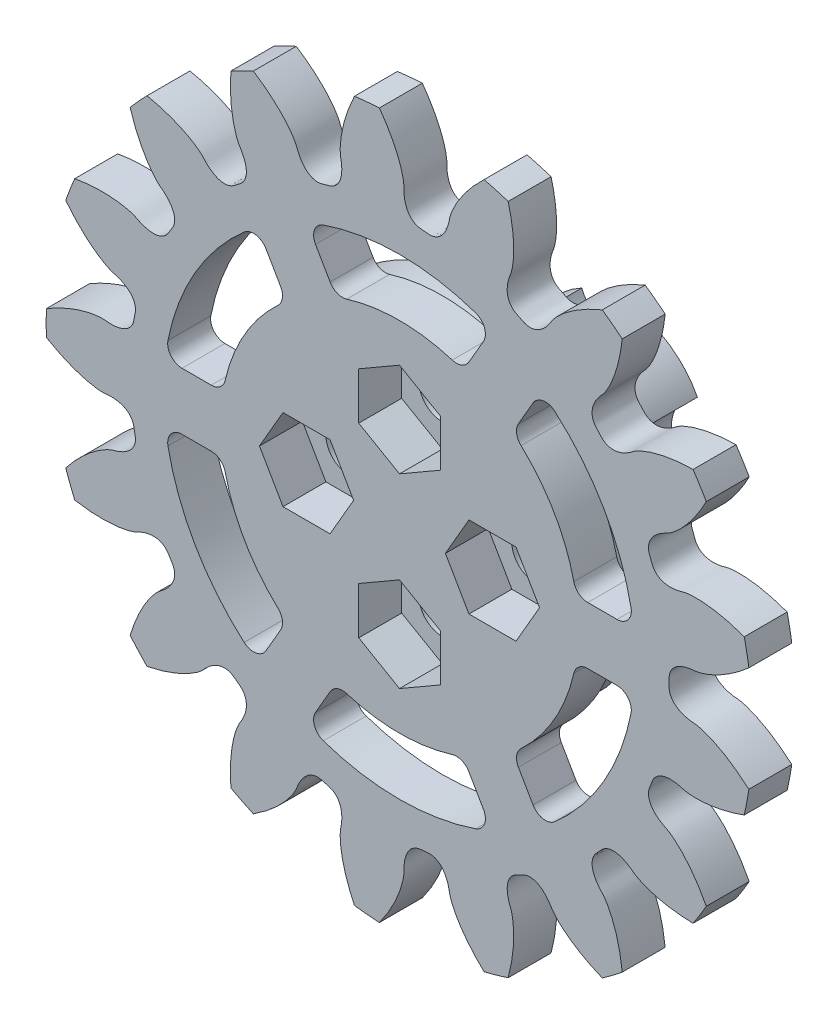
from build123d import *

# Parameters (mm, degrees)
EXTRUDE_1_DEPTH                  = 5
SKETCH_2_R                       = 10
EXTRUDE_2_DEPTH                  = 2.5
CUT_EXTRUDE_1_DEPTH              = 12.000000000000004
FILLET_1_R                       = 1
PATTERN_CIRCULAR_1_COUNT         = 6
FILLET_1_OF_PATTERN_CIRCULAR_1_R = 1
SKETCH_4_R                       = 12
EXTRUDE_3_DEPTH                  = 2.5
SKETCH_5_R                       = 6
SKETCH_5_R_2                     = 3
EXTRUDE_4_DEPTH                  = 10
SKETCH_6_R                       = 10
SKETCH_6_R_2                     = 6
EXTRUDE_6_DEPTH                  = 1.9
CUT_EXTRUDE_START                = -2
CUT_EXTRUDE_2_DEPTH              = 2
SKETCH_8_R                       = 1.6500000000000004
CUT_EXTRUDE_3_DEPTH              = 15
SKETCH_9_R                       = 3
CUT_EXTRUDE_4_DEPTH              = 10
SKETCH_10_R                      = 3
CUT_EXTRUDE_6_DEPTH              = 2
PATTERN_CIRCULAR_2_COUNT         = 4
CUT_EXTRUDE_7_DEPTH              = 3
PATTERN_CIRCULAR_3_COUNT         = 4


with BuildPart() as part:
    # 草图1 → 凸台-拉伸1 (new body)
    with BuildSketch(Plane.XY):
        with BuildLine():
            ThreePointArc((14.176553775425596, -20.226598941176448), (14.88507529501673, -19.711025217791605), (15.57486344069606, -19.170644498253136))
            add(Edge.make_bspline(
                [(15.57486344069606, -19.170644498253136), (15.549480583625337, -18.941240250946194), (15.500523651221084, -18.583545126126847), (15.413865314146951, -18.107757722059173), (15.336103019540854, -17.74805104164547), (15.252032601040762, -17.41271667777427), (15.163161505561147, -17.101758812680345), (15.070990266641328, -16.8151088646446), (14.977008929428779, -16.552626418648547), (14.882694077336605, -16.314099749044694), (14.789505702956708, -16.09924662856046), (14.698884310970346, -15.907715122313308), (14.61224752383324, -15.739084863932106), (14.530988404070971, -15.592867342905185), (14.4564686315328, -15.468509762469974), (14.390027399737567, -15.365388616412655), (14.332944524608664, -15.28283383627568), (14.286531146394195, -15.220068397576505), (14.177607250500907, -15.08267020741051), (14.036715386039422, -14.946149434701887), (13.901356565566966, -14.770704918168672), (13.822913692903844, -14.661721891301994), (13.751712494, -14.551979928595646), (13.68742362652063, -14.441444800898921), (13.630186006581313, -14.329601855505661), (13.580147143758879, -14.215874375026196), (13.537658747908688, -14.099487440077201), (13.503340489429963, -13.979491527713495), (13.478228336935077, -13.854788515446755), (13.463951482480677, -13.724251290365476), (13.462933371961956, -13.587001655970306), (13.478477075602806, -13.442906724761055), (13.514690311790806, -13.293412443110087), (13.575317953562136, -13.142110485100053), (13.656558282241306, -13.008364150448482), (13.775592260431997, -12.859232853412513), (13.933521688175775, -12.702083348712112), (14.075428931584904, -12.530327693075742), (14.212940990910774, -12.398041392728764), (14.338620875428036, -12.304807066086937), (14.483683392914626, -12.230477667697881), (14.629198622421242, -12.180625318674162), (14.77124467802225, -12.151852518823107), (14.90800276906084, -12.140202487659266), (15.039300447291781, -12.142373983962354), (15.165788555606014, -12.155872870079856), (15.288439075971729, -12.17897290694195), (15.40824985935599, -12.210541223235227), (15.526109202235359, -12.249873181040723), (15.642756266632311, -12.29654707029511), (15.75875169929516, -12.35036279790398), (15.874595139950234, -12.411134554182514), (15.990351059609681, -12.479187118281603), (16.17753649706926, -12.597780544171671), (16.326474757425018, -12.725474841047395), (16.47333706031481, -12.821256581203706), (16.540117238982738, -12.861680704069391), (16.62758679822323, -12.910902879587324), (16.736398471109695, -12.967545865828296), (16.867101381190064, -13.030273480220698), (17.02019280972161, -13.097694712113691), (17.19609755536754, -13.168402684693797), (17.39517350914596, -13.240965203931085), (17.617708442520833, -13.31393190818187), (17.8639198760788, -13.385835965249665), (18.133954122039345, -13.455197569966126), (18.42788576093657, -13.52052690218454), (18.745717124781937, -13.580327317163938), (19.087378050969058, -13.63309835445384), (19.452725285450008, -13.677339383530475), (19.934478886926563, -13.719727928189455), (20.29516532324062, -13.735472076595837), (20.525933007051812, -13.739579901320235)],
                knots=[0.01067691107641427, 0.01067691107641427, 0.01067691107641427, 0.01067691107641427, 0.05836461635386098, 0.08524305814521344, 0.11058558901559495, 0.13439220896756504, 0.15666291800421156, 0.17739771612931104, 0.19659660334754353, 0.21425957966481185, 0.2303866450887046, 0.24497779962920668, 0.2580330432998284, 0.2695523761194814, 0.2795357981158086, 0.2879833093315301, 0.2948949098378451, 0.30027059976698073, 0.3041103794098386, 0.3311136183101659, 0.34062545006852535, 0.3498621579081577, 0.3588552365029907, 0.36764307163821847, 0.3762726265149557, 0.38480146098125584, 0.39330001117192687, 0.4018538594319255, 0.41056531638160615, 0.41955288191536394, 0.42894595962123644, 0.4388708483181512, 0.44942390553716544, 0.4606320446258488, 0.47241250059468026, 0.48161435063433206, 0.4999999999999963, 0.5183856493656605, 0.5275874994053122, 0.5393679553741438, 0.5505760944628271, 0.5611291516818413, 0.5710540403787561, 0.5804471180846286, 0.5894346836183864, 0.598146140568067, 0.6066999888280655, 0.6151985390187367, 0.6237273734850367, 0.632356928361774, 0.6411447634970018, 0.6501378420918348, 0.6593745499314672, 0.6688863816898265, 0.6958896205901538, 0.6997294002330117, 0.7051050901621472, 0.7120166906684623, 0.7204642018841837, 0.7304476238805108, 0.7419669567001639, 0.7550222003707855, 0.7696133549112877, 0.7857404203351803, 0.8034033966524485, 0.8226022838706812, 0.8433370819957806, 0.8656077910324272, 0.8894144109843972, 0.9147569418547787, 0.9416353836461312, 0.9893230889235818, 0.9893230889235818, 0.9893230889235818, 0.9893230889235818], degree=3))
            ThreePointArc((20.525933007051812, -13.739579901320235), (21.000362937128102, -13.00287422778672), (21.44836319564495, -12.249803994450211))
            add(Edge.make_bspline(
                [(21.44836319564495, -12.249803994450211), (21.341824013796003, -12.045060250109897), (21.16695865101544, -11.729204763455662), (20.91427792365118, -11.316850824135834), (20.711825702864942, -11.009525314788872), (20.512295627964566, -10.727205070970026), (20.317094862132546, -10.469349439862008), (20.127597836649137, -10.235352415680405), (19.94514325347965, -10.024544798928115), (19.771031501525552, -9.836195757866186), (19.606522031083728, -9.669514713244036), (19.45283093922242, -9.523653125245934), (19.311128265665054, -9.397706909606695), (19.182536532179373, -9.290717311612564), (19.068125774186583, -9.20167696813639), (18.96891951602924, -9.129520704450826), (18.88586909386858, -9.07316137749083), (18.819916415956094, -9.03140079501704), (18.66871395677041, -8.94262864795692), (18.488019214408652, -8.866222830539582), (18.298423003837296, -8.75152293691169), (18.185907993272796, -8.678236124903409), (18.079871483135978, -8.60162563200596), (17.979994005850234, -8.521778512660633), (17.886219182834473, -8.4381646852221), (17.79847622832191, -8.350193090134958), (17.716813168816284, -8.25701408434007), (17.641464822505434, -8.157518413292374), (17.573000513753595, -8.050307873239362), (17.51253225876381, -7.9337429306385845), (17.462002612366152, -7.806129242009333), (17.424443591314176, -7.666149686856835), (17.404207865007308, -7.513668690983973), (17.406084885884425, -7.350682586554638), (17.433524487509466, -7.196620452013772), (17.490647928305886, -7.014559626378187), (17.581143784964226, -6.81097138776227), (17.651423049375413, -6.599551199585077), (17.731861902353913, -6.426522812749171), (17.81537478095908, -6.294183581439228), (17.923790674322053, -6.172470856094942), (18.041470839167705, -6.073418761097176), (18.163530907153003, -5.995275970473236), (18.286845552524085, -5.9350099192699055), (18.410061426202358, -5.889604587218138), (18.53288443466802, -5.856499148650307), (18.655597334636095, -5.833732813186792), (18.778721354101602, -5.819888744442407), (18.90283026028452, -5.813988997426672), (19.02846096199791, -5.815373323096083), (19.156063964802264, -5.823652611231318), (19.28603804666695, -5.838473108774089), (19.418560648782005, -5.860114373647443), (19.63594675772934, -5.903080270565986), (19.820956049972867, -5.968348950925985), (19.992501424368342, -6.004609980709775), (20.069374963949, -6.0181805696697825), (20.168718999556454, -6.0324812320904275), (20.29064466948561, -6.045991933736549), (20.43518133137695, -6.057268355161309), (20.60229019518787, -6.064833778852049), (20.791859151350693, -6.067222876273119), (21.00370455514327, -6.0629708811167955), (21.237570814407427, -6.050621416384628), (21.493130880142854, -6.028728124289045), (21.769986617146394, -5.995858273535688), (22.067669384582835, -5.950595706614537), (22.3856407065482, -5.891544001447645), (22.72329312952728, -5.817329365990461), (23.079950982827935, -5.7266042532839245), (23.544485346120208, -5.5921009203342384), (23.886502873908913, -5.476486932273611), (24.103171247954663, -5.396954462150269)],
                knots=[0.01067691107641391, 0.01067691107641391, 0.01067691107641391, 0.01067691107641391, 0.0583646163538605, 0.08524305814521296, 0.11058558901559448, 0.13439220896756457, 0.1566629180042111, 0.17739771612931057, 0.19659660334754306, 0.21425957966481138, 0.23038664508870413, 0.2449777996292062, 0.2580330432998279, 0.2695523761194809, 0.2795357981158081, 0.2879833093315296, 0.2948949098378446, 0.30027059976698023, 0.3041103794098381, 0.3311136183101654, 0.34062545006852485, 0.3498621579081572, 0.3588552365029902, 0.36764307163821797, 0.3762726265149552, 0.38480146098125534, 0.39330001117192637, 0.401853859431925, 0.41056531638160565, 0.41955288191536344, 0.42894595962123594, 0.4388708483181507, 0.44942390553716494, 0.4606320446258483, 0.47241250059467976, 0.48161435063433156, 0.4999999999999958, 0.51838564936566, 0.5275874994053118, 0.5393679553741434, 0.5505760944628266, 0.5611291516818409, 0.5710540403787556, 0.5804471180846281, 0.5894346836183859, 0.5981461405680666, 0.6066999888280651, 0.6151985390187362, 0.6237273734850363, 0.6323569283617736, 0.6411447634970013, 0.6501378420918343, 0.6593745499314667, 0.6688863816898261, 0.6958896205901534, 0.6997294002330112, 0.7051050901621467, 0.7120166906684618, 0.7204642018841833, 0.7304476238805103, 0.7419669567001634, 0.755022200370785, 0.7696133549112872, 0.7857404203351799, 0.8034033966524481, 0.8226022838706808, 0.8433370819957802, 0.8656077910324268, 0.8894144109843968, 0.9147569418547783, 0.9416353836461308, 0.9893230889235817, 0.9893230889235817, 0.9893230889235817, 0.9893230889235817], degree=3))
            ThreePointArc((24.103171247954663, -5.396954462150269), (24.27943519755226, -4.538613021905829), (24.425142651538746, -3.674559582689585))
            add(Edge.make_bspline(
                [(24.425142651538746, -3.674559582689585), (24.251835851774246, -3.522128118513311), (23.974678594823327, -3.290770303712508), (23.59010140955173, -2.997540513577727), (23.29030155682901, -2.7841021882842467), (23.002259467777957, -2.592924977835967), (22.727091976663935, -2.422996412522371), (22.465861787947723, -2.2732549069329053), (22.21957546129409, -2.142592856192104), (21.989181566365996, -2.0298590253455755), (21.775568915423854, -1.9338612552732837), (21.579564957275217, -1.8533690012303343), (21.40193412856314, -1.7871165626472083), (21.24337680751268, -1.7338044257448055), (21.104526870904092, -1.6921067110036996), (20.985953941269635, -1.660660432932285), (20.888152391788296, -1.6381081985530312), (20.811567688786273, -1.622992470371083), (20.638507396262966, -1.5948355367807527), (20.442413602221023, -1.5888637036761668), (20.224186020377303, -1.5503992891620864), (20.092794647555355, -1.522706482070175), (19.96624364444812, -1.4895741305608212), (19.844266564103652, -1.4511988154826392), (19.72661934748397, -1.4071066167146133), (19.6130224734887, -1.356771958403751), (19.503213799024497, -1.2993852228182663), (19.397011576570403, -1.2338272347861143), (19.294441595832375, -1.1585885444551056), (19.195948513209746, -1.0717386257417059), (19.102731639673586, -0.9709958186596134), (19.017142447843582, -0.8540366541407058), (18.94319070600961, -0.7191623474649448), (18.88606360392213, -0.5665042731566736), (18.855996608245512, -0.41293328368401394), (18.843494674436187, -0.2225312527847616), (18.854334993112523, 2.2047e-13), (18.84349467443619, 0.2225312527852003), (18.855996608245505, 0.41293328368445426), (18.88606360392211, 0.5665042731571119), (18.9431907060096, 0.7191623474653872), (19.017142447843568, 0.8540366541411474), (19.102731639673568, 0.9709958186600582), (19.195948513209736, 1.071738625742151), (19.294441595832357, 1.1585885444555524), (19.397011576570385, 1.2338272347865633), (19.503213799024472, 1.2993852228187177), (19.613022473488677, 1.3567719584042033), (19.72661934748395, 1.407106616715068), (19.844266564103627, 1.4511988154830957), (19.966243644448102, 1.4895741305612806), (20.09279464755533, 1.5227064820706355), (20.22418602037727, 1.5503992891625495), (20.44241360222101, 1.5888637036766342), (20.638507396262934, 1.5948355367812237), (20.811567688786248, 1.622992470371556), (20.888152391788275, 1.6381081985535064), (20.9859539412696, 1.6606604329327603), (21.104526870904063, 1.6921067110041774), (21.243376807512654, 1.7338044257452865), (21.40193412856311, 1.787116562647692), (21.579564957275185, 1.8533690012308202), (21.775568915423822, 1.933861255273772), (21.989181566365954, 2.0298590253460693), (22.21957546129406, 2.1425928561926018), (22.46586178794768, 2.273254906933406), (22.727091976663893, 2.4229964125228767), (23.002259467777904, 2.5929249778364767), (23.29030155682897, 2.7841021882847614), (23.590101409551675, 2.997540513578247), (23.97467859482328, 3.2907703037130474), (24.25183585177422, 3.5221281185138698), (24.42514265153873, 3.6745595826901627)],
                knots=[0.01067691107641412, 0.01067691107641412, 0.01067691107641412, 0.01067691107641412, 0.05836461635386049, 0.08524305814521295, 0.11058558901559447, 0.13439220896756454, 0.15666291800421106, 0.17739771612931055, 0.19659660334754303, 0.21425957966481135, 0.2303866450887041, 0.24497779962920618, 0.2580330432998279, 0.2695523761194809, 0.2795357981158081, 0.2879833093315296, 0.2948949098378446, 0.30027059976698023, 0.3041103794098381, 0.3311136183101654, 0.34062545006852485, 0.3498621579081572, 0.3588552365029902, 0.36764307163821797, 0.3762726265149552, 0.38480146098125534, 0.39330001117192637, 0.401853859431925, 0.41056531638160565, 0.41955288191536344, 0.42894595962123594, 0.4388708483181507, 0.44942390553716494, 0.4606320446258483, 0.47241250059467976, 0.48161435063433156, 0.4999999999999958, 0.51838564936566, 0.5275874994053118, 0.5393679553741434, 0.5505760944628266, 0.5611291516818409, 0.5710540403787556, 0.5804471180846281, 0.5894346836183859, 0.5981461405680666, 0.6066999888280651, 0.6151985390187362, 0.6237273734850363, 0.6323569283617736, 0.6411447634970013, 0.6501378420918343, 0.6593745499314667, 0.6688863816898261, 0.6958896205901534, 0.6997294002330112, 0.7051050901621467, 0.7120166906684618, 0.7204642018841833, 0.7304476238805103, 0.7419669567001634, 0.755022200370785, 0.7696133549112872, 0.7857404203351799, 0.8034033966524481, 0.8226022838706808, 0.8433370819957802, 0.8656077910324268, 0.8894144109843968, 0.9147569418547783, 0.9416353836461308, 0.9893230889235815, 0.9893230889235815, 0.9893230889235815, 0.9893230889235815], degree=3))
            ThreePointArc((24.42514265153873, 3.6745595826901627), (24.27943519755224, 4.538613021906406), (24.103171247954638, 5.396954462150846))
            add(Edge.make_bspline(
                [(24.103171247954638, 5.396954462150846), (23.88650287390891, 5.476486932274173), (23.544485346120236, 5.592100920334788), (23.079950982827977, 5.726604253284461), (22.723293129527317, 5.817329365990987), (22.38564070654824, 5.891544001448168), (22.06766938458287, 5.9505957066150525), (21.769986617146436, 5.995858273536198), (21.493130880142882, 6.028728124289547), (21.237570814407462, 6.050621416385129), (21.003704555143305, 6.062970881117292), (20.791859151350728, 6.067222876273611), (20.6022901951879, 6.064833778852537), (20.435181331376977, 6.057268355161793), (20.290644669485637, 6.045991933737031), (20.16871899955649, 6.032481232090908), (20.069374963949027, 6.018180569670258), (19.992501424368378, 6.004609980710249), (19.82095604997291, 5.968348950926459), (19.635946757729368, 5.903080270566451), (19.41856064878205, 5.860114373647911), (19.286038046666988, 5.8384731087745525), (19.156063964802293, 5.823652611231775), (19.02846096199795, 5.8153733230965425), (18.90283026028456, 5.813988997427127), (18.77872135410164, 5.819888744442859), (18.655597334636134, 5.833732813187242), (18.53288443466806, 5.856499148650754), (18.41006142620239, 5.8896045872185825), (18.286845552524113, 5.935009919270345), (18.163530907153046, 5.995275970473679), (18.04147083916774, 6.0734187610976145), (17.92379067432208, 6.17247085609538), (17.815374780959115, 6.294183581439663), (17.73186190235394, 6.426522812749604), (17.651423049375428, 6.599551199585505), (17.581143784964247, 6.810971387762701), (17.490647928305904, 7.014559626378618), (17.433524487509477, 7.1966204520142), (17.406084885884425, 7.3506825865550605), (17.404207865007315, 7.513668690984403), (17.42444359131418, 7.666149686857261), (17.462002612366145, 7.806129242009759), (17.512532258763812, 7.933742930639014), (17.573000513753588, 8.050307873239792), (17.641464822505426, 8.157518413292804), (17.716813168816277, 8.257014084340504), (17.7984762283219, 8.350193090135392), (17.886219182834463, 8.438164685222535), (17.97999400585022, 8.521778512661069), (18.07987148313597, 8.601625632006405), (18.185907993272778, 8.678236124903849), (18.29842300383727, 8.75152293691213), (18.488019214408638, 8.866222830540034), (18.668713956770382, 8.942628647957367), (18.819916415956072, 9.031400795017495), (18.88586909386856, 9.073161377491289), (18.96891951602921, 9.12952070445128), (19.06812577418656, 9.20167696813685), (19.182536532179352, 9.290717311613026), (19.311128265665022, 9.397706909607157), (19.452830939222384, 9.523653125246398), (19.606522031083692, 9.669514713244503), (19.771031501525513, 9.836195757866657), (19.945143253479614, 10.024544798928593), (20.12759783664908, 10.235352415680884), (20.317094862132496, 10.46934943986249), (20.5122956279645, 10.727205070970511), (20.71182570286489, 11.009525314789366), (20.914277923651106, 11.316850824136326), (21.166958651015374, 11.729204763456178), (21.341824013795943, 12.045060250110435), (21.448363195644905, 12.24980399445077)],
                knots=[0.01067691107641422, 0.01067691107641422, 0.01067691107641422, 0.01067691107641422, 0.05836461635386092, 0.08524305814521338, 0.1105855890155949, 0.13439220896756499, 0.1566629180042115, 0.177397716129311, 0.19659660334754347, 0.2142595796648118, 0.23038664508870454, 0.24497779962920663, 0.25803304329982835, 0.26955237611948135, 0.27953579811580853, 0.28798330933153005, 0.29489490983784505, 0.3002705997669807, 0.30411037940983854, 0.33111361831016584, 0.3406254500685253, 0.34986215790815767, 0.35885523650299067, 0.3676430716382184, 0.37627262651495563, 0.3848014609812558, 0.3933000111719268, 0.4018538594319254, 0.4105653163816061, 0.4195528819153639, 0.4289459596212364, 0.43887084831815115, 0.4494239055371654, 0.4606320446258487, 0.4724125005946802, 0.481614350634332, 0.4999999999999962, 0.5183856493656605, 0.5275874994053122, 0.5393679553741438, 0.5505760944628271, 0.5611291516818413, 0.5710540403787561, 0.5804471180846286, 0.5894346836183864, 0.598146140568067, 0.6066999888280655, 0.6151985390187367, 0.6237273734850367, 0.632356928361774, 0.6411447634970018, 0.6501378420918348, 0.6593745499314672, 0.6688863816898265, 0.6958896205901538, 0.6997294002330117, 0.7051050901621472, 0.7120166906684623, 0.7204642018841837, 0.7304476238805108, 0.7419669567001639, 0.7550222003707855, 0.7696133549112877, 0.7857404203351803, 0.8034033966524485, 0.8226022838706812, 0.8433370819957806, 0.8656077910324272, 0.8894144109843972, 0.9147569418547787, 0.9416353836461312, 0.9893230889235818, 0.9893230889235818, 0.9893230889235818, 0.9893230889235818], degree=3))
            ThreePointArc((21.448363195644905, 12.24980399445077), (21.000362937128074, 13.00287422778727), (20.525933007051805, 13.73957990132078))
            add(Edge.make_bspline(
                [(20.525933007051805, 13.73957990132078), (20.295165323240642, 13.735472076596379), (19.93447888692661, 13.71972792819), (19.452725285450082, 13.677339383531015), (19.087378050969118, 13.633098354454363), (18.74571712478201, 13.58032731716446), (18.42788576093664, 13.520526902185056), (18.13395412203942, 13.455197569966638), (17.86391987607886, 13.385835965250164), (17.617708442520904, 13.313931908182374), (17.39517350914603, 13.240965203931584), (17.19609755536762, 13.168402684694293), (17.020192809721685, 13.097694712114182), (16.867101381190142, 13.030273480221185), (16.736398471109766, 12.967545865828779), (16.62758679822331, 12.91090287958781), (16.54011723898281, 12.861680704069872), (16.473337060314893, 12.821256581204185), (16.326474757425103, 12.725474841047879), (16.177536497069337, 12.597780544172137), (15.990351059609775, 12.479187118282079), (15.874595139950321, 12.411134554182986), (15.758751699295244, 12.350362797904442), (15.6427562666324, 12.296547070295576), (15.52610920223545, 12.24987318104119), (15.408249859356085, 12.21054122323569), (15.28843907597182, 12.178972906942413), (15.165788555606104, 12.155872870080316), (15.039300447291872, 12.142373983962813), (14.908002769060925, 12.140202487659717), (14.77124467802234, 12.151852518823562), (14.629198622421333, 12.180625318674611), (14.483683392914713, 12.23047766769833), (14.338620875428132, 12.304807066087385), (14.212940990910859, 12.398041392729207), (14.075428931584982, 12.530327693076178), (13.933521688175855, 12.702083348712552), (13.77559226043208, 12.85923285341295), (13.656558282241381, 13.008364150448916), (13.575317953562205, 13.142110485100478), (13.51469031179088, 13.293412443110523), (13.478477075602875, 13.442906724761484), (13.462933371962018, 13.587001655970736), (13.463951482480745, 13.724251290365908), (13.478228336935137, 13.854788515447183), (13.50334048943002, 13.979491527713927), (13.537658747908747, 14.099487440077635), (13.580147143758932, 14.215874375026628), (13.630186006581363, 14.329601855506096), (13.687423626520678, 14.441444800899351), (13.751712494000053, 14.551979928596085), (13.82291369290389, 14.661721891302427), (13.901356565567003, 14.770704918169105), (14.036715386039473, 14.946149434702333), (14.177607250500943, 15.08267020741095), (14.286531146394234, 15.220068397576952), (14.3329445246087, 15.282833836276128), (14.3900273997376, 15.365388616413098), (14.456468631532834, 15.468509762470426), (14.530988404071003, 15.592867342905631), (14.612247523833268, 15.739084863932558), (14.69888431097037, 15.907715122313755), (14.789505702956731, 16.09924662856091), (14.882694077336625, 16.314099749045145), (14.977008929428797, 16.552626418649005), (15.070990266641333, 16.81510886464505), (15.163161505561149, 17.1017588126808), (15.252032601040758, 17.41271667777473), (15.336103019540856, 17.748051041645937), (15.413865314146934, 18.10775772205963), (15.500523651221062, 18.583545126127326), (15.549480583625323, 18.9412402509467), (15.574863440696037, 19.170644498253655)],
                knots=[0.01067691107641406, 0.01067691107641406, 0.01067691107641406, 0.01067691107641406, 0.05836461635386032, 0.08524305814521277, 0.11058558901559429, 0.13439220896756437, 0.1566629180042109, 0.17739771612931038, 0.19659660334754286, 0.21425957966481118, 0.23038664508870393, 0.24497779962920602, 0.25803304329982774, 0.26955237611948074, 0.2795357981158079, 0.28798330933152944, 0.29489490983784444, 0.30027059976698006, 0.3041103794098379, 0.3311136183101652, 0.3406254500685247, 0.34986215790815706, 0.35885523650299006, 0.3676430716382178, 0.376272626514955, 0.3848014609812552, 0.3933000111719262, 0.4018538594319248, 0.4105653163816055, 0.4195528819153633, 0.4289459596212358, 0.43887084831815054, 0.44942390553716477, 0.4606320446258481, 0.4724125005946796, 0.4816143506343314, 0.4999999999999956, 0.5183856493656599, 0.5275874994053117, 0.5393679553741433, 0.5505760944628265, 0.5611291516818407, 0.5710540403787555, 0.580447118084628, 0.5894346836183858, 0.5981461405680665, 0.606699988828065, 0.6151985390187361, 0.6237273734850362, 0.6323569283617735, 0.6411447634970012, 0.6501378420918342, 0.6593745499314666, 0.668886381689826, 0.6958896205901532, 0.6997294002330111, 0.7051050901621466, 0.7120166906684617, 0.7204642018841831, 0.7304476238805102, 0.7419669567001633, 0.7550222003707849, 0.7696133549112871, 0.7857404203351798, 0.803403396652448, 0.8226022838706807, 0.8433370819957801, 0.8656077910324267, 0.8894144109843967, 0.9147569418547782, 0.9416353836461306, 0.9893230889235813, 0.9893230889235813, 0.9893230889235813, 0.9893230889235813], degree=3))
            ThreePointArc((15.574863440696037, 19.170644498253655), (14.885075295016696, 19.711025217792105), (14.176553775425546, 20.226598941176928))
            add(Edge.make_bspline(
                [(14.176553775425546, 20.226598941176928), (13.96285323627551, 20.139405606096062), (13.632210593292871, 19.994429655706305), (13.198301247000334, 19.780874041277894), (12.873606799814638, 19.607641866542878), (12.574080571709617, 19.4350121775063), (12.299314052835937, 19.264436019789112), (12.04883063904245, 19.097337876749553), (11.822087505353277, 18.935112485626142), (11.618476922379433, 18.779122120736115), (11.437327890754757, 18.630693805233907), (11.277907697666214, 18.491116741908797), (11.139424073158496, 18.361639397673), (11.021025925638407, 18.24346796853884), (10.921808919625185, 18.137760873088194), (10.84080686315104, 18.04563555141384), (10.777025028938489, 17.968139590351804), (10.729357244354151, 17.90632143537125), (10.62701258076742, 17.763954839595478), (10.534260289655853, 17.5910807485756), (10.402555954243276, 17.412876493029337), (10.319200195415142, 17.307603505578363), (10.233132694540808, 17.209088052997398), (10.144410657953468, 17.117003998131718), (10.052501063283456, 17.031344112665113), (9.956808841044664, 16.952092448885914), (9.856492403932165, 16.87937522359646), (9.750468895574187, 16.813528602388708), (9.637398607334035, 16.75524849095595), (9.515751603541055, 16.705793438906404), (9.384020004832468, 16.667254048767038), (9.241172068529035, 16.642770931789727), (9.087474412434041, 16.63669069886234), (8.92535676762957, 16.653598173170312), (8.774483642020535, 16.6951357827018), (8.59847014193988, 16.768813998674283), (8.404100279090393, 16.877708568745202), (8.20006652459514, 16.96719542812483), (8.035198207354869, 17.063256188531426), (7.9111291081778985, 17.15862353968497), (7.7999389444829355, 17.27780718345337), (7.712167544011715, 17.40412471976906), (7.645620378985375, 17.53287420811768), (7.596989452158059, 17.661223464627227), (7.563146737772222, 17.788103196610038), (7.541515198664471, 17.913456848280642), (7.530168498339489, 18.037746889075336), (7.527743937238339, 18.161623052691304), (7.533320682671561, 18.285746892138615), (7.546290841797034, 18.410713945968084), (7.566308531680029, 18.53700870052448), (7.593058302899467, 18.66506087287502), (7.6268348930410825, 18.795021352925957), (7.6896753646607285, 19.00751573823507), (7.771736124217632, 19.185713579392953), (7.823670681109992, 19.35318142573326), (7.844276375713168, 19.42847490036619), (7.8676823452170295, 19.526075653170814), (7.892385294132625, 19.64623459941086), (7.91694977300658, 19.789114236478184), (7.939901784649211, 19.954812194103962), (7.959771907192185, 20.143352044420222), (7.975084678165375, 20.354686077685027), (7.984366350148726, 20.588694169567713), (7.986146558987286, 20.845184119261592), (7.978961949883772, 21.12389168570419), (7.961359165685399, 21.42448089372965), (7.93189805691635, 21.746544410051538), (7.889154643147444, 22.08960412998244), (7.831724782791082, 22.453111601069473), (7.740657040962797, 22.928074744536655), (7.657093637989824, 23.279300798857168), (7.597892074783633, 23.50238323435913)],
                knots=[0.01067691107641427, 0.01067691107641427, 0.01067691107641427, 0.01067691107641427, 0.05836461635386108, 0.08524305814521355, 0.11058558901559506, 0.13439220896756515, 0.15666291800421167, 0.17739771612931116, 0.19659660334754364, 0.21425957966481196, 0.2303866450887047, 0.2449777996292068, 0.2580330432998285, 0.2695523761194815, 0.2795357981158087, 0.2879833093315302, 0.2948949098378452, 0.30027059976698084, 0.3041103794098387, 0.331113618310166, 0.34062545006852546, 0.34986215790815783, 0.35885523650299084, 0.3676430716382186, 0.3762726265149558, 0.38480146098125595, 0.393300011171927, 0.4018538594319256, 0.41056531638160626, 0.41955288191536405, 0.42894595962123655, 0.4388708483181513, 0.44942390553716555, 0.4606320446258489, 0.4724125005946804, 0.48161435063433217, 0.4999999999999964, 0.5183856493656606, 0.5275874994053124, 0.539367955374144, 0.5505760944628272, 0.5611291516818414, 0.5710540403787562, 0.5804471180846287, 0.5894346836183865, 0.5981461405680671, 0.6066999888280656, 0.6151985390187368, 0.6237273734850368, 0.6323569283617742, 0.6411447634970019, 0.6501378420918349, 0.6593745499314673, 0.6688863816898266, 0.6958896205901539, 0.6997294002330118, 0.7051050901621473, 0.7120166906684624, 0.7204642018841838, 0.7304476238805109, 0.741966956700164, 0.7550222003707856, 0.7696133549112878, 0.7857404203351804, 0.8034033966524486, 0.8226022838706814, 0.8433370819957807, 0.8656077910324274, 0.8894144109843973, 0.9147569418547788, 0.9416353836461313, 0.9893230889235819, 0.9893230889235819, 0.9893230889235819, 0.9893230889235819], degree=3))
            ThreePointArc((7.597892074783633, 23.50238323435913), (6.759475753263825, 23.75709302957293), (5.912552401431849, 23.981903714573335))
            add(Edge.make_bspline(
                [(5.912552401431849, 23.981903714573335), (5.744780448910735, 23.82340081219363), (5.488836720348427, 23.568772865260108), (5.16137349083138, 23.21289205014333), (4.92118361522742, 22.93406469486053), (4.704244762042196, 22.664890950155804), (4.509651829047943, 22.406576304995657), (4.3364458133675035, 22.160276881275227), (4.183616708581519, 21.92709714173801), (4.050105713667591, 21.708087832176595), (3.9348077642954578, 21.504243971901232), (3.8365739123511826, 21.316503020313576), (3.7542143898357065, 21.14574293721986), (3.686499849216442, 20.992781017159604), (3.6321685537128636, 20.85837076963456), (3.58991589022575, 20.743205147702984), (3.5584358711788995, 20.647901660058217), (3.5363182791225674, 20.573038357339136), (3.4923134687676405, 20.403314303583954), (3.4682738577730894, 20.20860802234058), (3.4098380247038773, 19.9948604093135), (3.3701400838270033, 19.86658469880367), (3.3254724156429796, 19.743630607684306), (3.276006177798036, 19.625714687426786), (3.2212469529037966, 19.51263764793804), (3.160645616167835, 19.404169654527152), (3.0933718160317096, 19.300124384456918), (3.0182943819817596, 19.200424129966336), (2.933912682786615, 19.105233845208563), (2.8383454553631635, 19.015174416231766), (2.7294314313401467, 18.931650562981634), (2.605074019679813, 18.85721810978939), (2.463951657120185, 18.796026464059473), (2.3066737712535486, 18.753228566193528), (2.1509836561831044, 18.737459574279605), (1.9602403138580304, 18.742579054545438), (1.7396585585865996, 18.773905723957174), (1.5170763664745208, 18.783644241793006), (1.3286400899948547, 18.81366092758627), (1.1784984396545555, 18.85776940601978), (1.0317626017689236, 18.928738324036242), (0.9042870510062462, 19.014819231787595), (0.7957239879817969, 19.110834945448556), (0.7040118999497397, 19.212949545773075), (0.6266202628304329, 19.31903597378828), (0.5611664913410473, 19.42811055959607), (0.5056872669654854, 19.539908670097535), (0.4586771993246631, 19.654543900062624), (0.41903865699610515, 19.772300486166486), (0.385989663447708, 19.893514155346143), (0.35903267579377784, 20.018511730335977), (0.33771831450003115, 20.14757995689319), (0.3222669064589787, 20.280966007161627), (0.3041020753224913, 20.501811717038585), (0.3162489696823047, 20.697620020769044), (0.30418013788610654, 20.87254006266402), (0.2961952356417337, 20.95019277226598), (0.2827631936421056, 21.049657975247552), (0.2623915895432478, 21.170626590156893), (0.23368320576458282, 21.312731597146993), (0.19522831293375972, 21.475531564030184), (0.14564820072902038, 21.65851765476091), (0.08358427611811951, 21.86111238280866), (0.00770570447205908, 22.082671356597437), (-0.08328915701111972, 22.3224841974153), (-0.1906693911599615, 22.57977588308443), (-0.31566884493013847, 22.85370811293347), (-0.45948327195895006, 23.143380817988497), (-0.6232677831179309, 23.447833777842888), (-0.808133577565768, 23.766048341368528), (-1.0646281951387837, 24.17604081984833), (-1.2694262328766877, 24.47336277882324), (-1.4052167172016068, 24.65999488346322)],
                knots=[0.01067691107641412, 0.01067691107641412, 0.01067691107641412, 0.01067691107641412, 0.05836461635386071, 0.08524305814521317, 0.11058558901559469, 0.13439220896756476, 0.15666291800421128, 0.17739771612931077, 0.19659660334754325, 0.21425957966481157, 0.23038664508870432, 0.2449777996292064, 0.2580330432998281, 0.26955237611948113, 0.2795357981158083, 0.2879833093315298, 0.29489490983784483, 0.30027059976698045, 0.3041103794098383, 0.3311136183101656, 0.34062545006852507, 0.34986215790815745, 0.35885523650299045, 0.3676430716382182, 0.3762726265149554, 0.38480146098125556, 0.3933000111719266, 0.4018538594319252, 0.41056531638160587, 0.41955288191536366, 0.42894595962123616, 0.43887084831815093, 0.44942390553716516, 0.4606320446258485, 0.47241250059468, 0.4816143506343318, 0.499999999999996, 0.5183856493656602, 0.527587499405312, 0.5393679553741436, 0.5505760944628268, 0.5611291516818411, 0.5710540403787558, 0.5804471180846283, 0.5894346836183861, 0.5981461405680668, 0.6066999888280653, 0.6151985390187364, 0.6237273734850365, 0.6323569283617738, 0.6411447634970016, 0.6501378420918346, 0.6593745499314669, 0.6688863816898263, 0.6958896205901536, 0.6997294002330114, 0.705105090162147, 0.7120166906684621, 0.7204642018841835, 0.7304476238805105, 0.7419669567001637, 0.7550222003707853, 0.7696133549112875, 0.7857404203351801, 0.8034033966524483, 0.822602283870681, 0.8433370819957804, 0.865607791032427, 0.889414410984397, 0.9147569418547785, 0.941635383646131, 0.9893230889235817, 0.9893230889235817, 0.9893230889235817, 0.9893230889235817], degree=3))
            ThreePointArc((-1.4052167172016068, 24.65999488346322), (-2.2790284445153888, 24.59463378511304), (-3.14997193695897, 24.498319503000687))
            add(Edge.make_bspline(
                [(-3.14997193695897, 24.498319503000687), (-3.2491567710067106, 24.289913728583414), (-3.395834966373187, 23.96002270028166), (-3.5726263554320723, 23.50988036056172), (-3.6958726858159343, 23.163115004097786), (-3.800925369859014, 22.833750609490494), (-3.8890638630963013, 22.522584301087125), (-3.9616000484783838, 22.230347698651485), (-4.019874706904531, 21.95770582661851), (-4.065254714085453, 21.705255993214458), (-4.09912995425434, 21.47352683103395), (-4.12291043901671, 21.26297744700418), (-4.138022749654364, 21.07399672048864), (-4.145908459442946, 20.90690266439768), (-4.1480163019190215, 20.761942113519396), (-4.145813116085079, 20.63928994672719), (-4.140739768957143, 20.53905019660097), (-4.134320065120455, 20.461252450007457), (-4.114041928766071, 20.287093112205962), (-4.066122176970713, 20.09685080292576), (-4.0433974246364315, 19.876427631973584), (-4.03407612067274, 19.74247354390949), (-4.031311340066105, 19.61168644556954), (-4.0348410896458065, 19.483863858345625), (-4.045054408010967, 19.358641345599196), (-4.062380312914306, 19.23560622610866), (-4.087525776588679, 19.114284801515375), (-4.121517512843733, 18.9941959855691), (-4.16581440694243, 18.87495150291043), (-4.2223949743765266, 18.75645072192622), (-4.293781981256219, 18.6392227647684), (-4.382853710740521, 18.524893490609294), (-4.492341422715098, 18.41685470290729), (-4.623538299650762, 18.32013152612555), (-4.763018591433642, 18.249185622503198), (-4.942730830676783, 18.185054952884453), (-5.159733690035052, 18.134582881345896), (-5.370803361348719, 18.06325781684121), (-5.557358233767745, 18.02317650827657), (-5.713294973429315, 18.01006901956408), (-5.875758997507812, 18.02323846619813), (-6.025722419065035, 18.05745704180255), (-6.1616393368574425, 18.107771526604502), (-6.28404636041129, 18.16986032813364), (-6.394534750829238, 18.240825892232596), (-6.494970860168749, 18.318890284961082), (-6.587089831921977, 18.403097510851374), (-6.672336435975801, 18.49300968414306), (-6.75183686127992, 18.588495337438378), (-6.826441557792681, 18.689585044277386), (-6.896732532427049, 18.7964038245628), (-6.963232403634307, 18.909056726138395), (-7.025825011582876, 19.027853821417963), (-7.122541884375711, 19.22722441899557), (-7.181949360604547, 19.414198188868532), (-7.25639161847952, 19.572946505394853), (-7.291888712277467, 19.64247102124558), (-7.34034469407902, 19.730367347585723), (-7.403039553175827, 19.835808149410617), (-7.481143573299155, 19.95794645769845), (-7.575811824240716, 20.09586139620572), (-7.688146102307031, 20.248580441836804), (-7.819204645575242, 20.4150743240285), (-7.969995639292234, 20.594261412612536), (-8.141476210833915, 20.78500909155311), (-8.334549774391869, 20.986136228596717), (-8.550064028856301, 21.196415414717336), (-8.788808838871384, 21.41457540455594), (-9.051514441627114, 21.63930354507341), (-9.338849020249516, 21.869248560945746), (-9.72612949417829, 22.158898618372707), (-10.024503056859519, 22.362161503924618), (-10.218543204954036, 22.487137577806795)],
                knots=[0.01067691107641369, 0.01067691107641369, 0.01067691107641369, 0.01067691107641369, 0.05836461635386016, 0.08524305814521263, 0.11058558901559415, 0.13439220896756424, 0.15666291800421075, 0.17739771612931024, 0.19659660334754273, 0.21425957966481105, 0.2303866450887038, 0.24497779962920588, 0.25803304329982757, 0.2695523761194806, 0.27953579811580775, 0.28798330933152927, 0.2948949098378443, 0.3002705997669799, 0.30411037940983776, 0.33111361831016506, 0.3406254500685245, 0.3498621579081569, 0.3588552365029899, 0.36764307163821763, 0.37627262651495486, 0.384801460981255, 0.39330001117192603, 0.40185385943192464, 0.4105653163816053, 0.4195528819153631, 0.4289459596212356, 0.4388708483181504, 0.4494239055371646, 0.46063204462584795, 0.47241250059467943, 0.4816143506343312, 0.49999999999999545, 0.5183856493656597, 0.5275874994053115, 0.5393679553741431, 0.5505760944628263, 0.5611291516818405, 0.5710540403787553, 0.5804471180846278, 0.5894346836183856, 0.5981461405680663, 0.6066999888280648, 0.6151985390187359, 0.6237273734850359, 0.6323569283617733, 0.641144763497001, 0.650137842091834, 0.6593745499314664, 0.6688863816898257, 0.695889620590153, 0.6997294002330109, 0.7051050901621464, 0.7120166906684615, 0.7204642018841829, 0.73044762388051, 0.7419669567001631, 0.7550222003707847, 0.7696133549112869, 0.7857404203351795, 0.8034033966524478, 0.8226022838706805, 0.8433370819957798, 0.8656077910324265, 0.8894144109843964, 0.914756941854778, 0.9416353836461304, 0.9893230889235816, 0.9893230889235816, 0.9893230889235816, 0.9893230889235816], degree=3))
            ThreePointArc((-10.218543204954036, 22.487137577806795), (-11.00973722233015, 22.110532964403177), (-11.787075110666349, 21.706101492673216))
            add(Edge.make_bspline(
                [(-11.787075110666349, 21.706101492673216), (-11.80427736480043, 21.475939200869707), (-11.821880323914899, 21.115338702561164), (-11.824123215788317, 20.631729055542042), (-11.813780901102247, 20.2638582807806), (-11.79275946890615, 19.918785722833565), (-11.762539930482525, 19.59679248536889), (-11.724609871793522, 19.298086876715892), (-11.680459768328353, 19.022804667765975), (-11.631579966347184, 18.771009059393325), (-11.579457458418835, 18.542690902715762), (-11.525572889759925, 18.33776894725151), (-11.471396987227937, 18.156090471608426), (-11.418388857382666, 17.997431257661976), (-11.367988571024886, 17.861498129080704), (-11.321627088325036, 17.74792427219227), (-11.280685558664329, 17.656286193286782), (-11.246595575510572, 17.586061019588488), (-11.164773167126569, 17.430987581360966), (-11.051365880553776, 17.270902522081254), (-10.950549646540946, 17.073573163848025), (-10.893467991488116, 16.952031940087956), (-10.843644161031927, 16.831075356874557), (-10.800760710106632, 16.710609251378244), (-10.765048756703546, 16.59015325960244), (-10.736759270310918, 16.469167588680587), (-10.716380363318486, 16.346955140220793), (-10.70469562944269, 16.22269642284747), (-10.702925177439345, 16.09550237042744), (-10.712877565728364, 15.964564424543228), (-10.737096344616573, 15.829464648674428), (-10.778852761294496, 15.69067935554402), (-10.841918900489501, 15.550384662812677), (-10.929315903277036, 15.412799208101141), (-11.033748785480098, 15.296258030179388), (-11.178158787911627, 15.171538412968388), (-11.362275312746046, 15.046084133416214), (-11.533326334572969, 14.903328331758196), (-11.69280453367493, 14.798562231655504), (-11.833476241891171, 14.730009014778735), (-11.989726785466496, 14.683600383288026), (-12.141924686760959, 14.661335218498465), (-12.286839126431817, 14.659153224466719), (-12.423409338695777, 14.67283079050804), (-12.552072413049116, 14.69909119802541), (-12.673926407136754, 14.735602368866882), (-12.790243948683532, 14.780846057681176), (-12.90221406290515, 14.833892037075868), (-13.010839398220444, 14.894210890980835), (-13.116924020034626, 14.961523910413174), (-13.221055796029324, 15.035737427813338), (-13.323760001055046, 15.116760605818266), (-13.425040330370063, 15.204924540114021), (-13.587247095221878, 15.355893921438796), (-13.710185633186468, 15.508781313775495), (-13.836947477715412, 15.62991806513149), (-13.895162683853332, 15.681924716116711), (-13.972098356610648, 15.746381279892828), (-14.06864918258017, 15.822053904079167), (-14.185600458341192, 15.907730058338739), (-14.323696595528942, 16.00213379181162), (-14.483613672738253, 16.103960238985138), (-14.665966652174943, 16.211867353956347), (-14.871304908699651, 16.324482348112433), (-15.100111788906478, 16.440403334165417), (-15.35280302725749, 16.558202588241816), (-15.629725688145049, 16.67642936135123), (-15.931157071623202, 16.793612920479482), (-16.257303918621524, 16.90826546102152), (-16.60830115439967, 17.018885580677683), (-17.07406311068493, 17.149074371789922), (-17.42571519532439, 17.23082640490651), (-17.651798809974757, 17.27726773673676)],
                knots=[0.01067691107641401, 0.01067691107641401, 0.01067691107641401, 0.01067691107641401, 0.05836461635386049, 0.08524305814521295, 0.11058558901559447, 0.13439220896756457, 0.1566629180042111, 0.17739771612931057, 0.19659660334754306, 0.21425957966481138, 0.23038664508870413, 0.2449777996292062, 0.2580330432998279, 0.2695523761194809, 0.2795357981158081, 0.2879833093315296, 0.2948949098378446, 0.30027059976698023, 0.3041103794098381, 0.3311136183101654, 0.34062545006852485, 0.3498621579081572, 0.3588552365029902, 0.36764307163821797, 0.3762726265149552, 0.38480146098125534, 0.39330001117192637, 0.401853859431925, 0.41056531638160565, 0.41955288191536344, 0.42894595962123594, 0.4388708483181507, 0.44942390553716494, 0.4606320446258483, 0.47241250059467976, 0.48161435063433156, 0.4999999999999958, 0.51838564936566, 0.5275874994053118, 0.5393679553741434, 0.5505760944628266, 0.5611291516818409, 0.5710540403787556, 0.5804471180846281, 0.5894346836183859, 0.5981461405680666, 0.6066999888280651, 0.6151985390187362, 0.6237273734850363, 0.6323569283617736, 0.6411447634970013, 0.6501378420918343, 0.6593745499314667, 0.6688863816898261, 0.6958896205901534, 0.6997294002330112, 0.7051050901621467, 0.7120166906684618, 0.7204642018841833, 0.7304476238805103, 0.7419669567001634, 0.755022200370785, 0.7696133549112872, 0.7857404203351799, 0.8034033966524481, 0.8226022838706808, 0.8433370819957802, 0.8656077910324268, 0.8894144109843968, 0.9147569418547783, 0.9416353836461308, 0.9893230889235816, 0.9893230889235816, 0.9893230889235816, 0.9893230889235816], degree=3))
            ThreePointArc((-17.651798809974757, 17.27726773673676), (-18.253519981209156, 16.64028214815807), (-18.83226847624023, 15.982354198099781))
            add(Edge.make_bspline(
                [(-18.83226847624023, 15.982354198099781), (-18.76516489071887, 15.761520081791373), (-18.651315236411552, 15.418911208928947), (-18.478706716123696, 14.96714841721414), (-18.3361725432748, 14.627855210729061), (-18.191916055741377, 14.313678450506085), (-18.047419801773195, 14.02434525492583), (-17.904146163616762, 13.75951248768898), (-17.76353401437742, 13.518768329532184), (-17.626995891344052, 13.301633338349289), (-17.495915068834975, 13.10756181938856), (-17.371642856336877, 12.935943138087028), (-17.255495496471227, 12.786103598167188), (-17.148752568655897, 12.657307032369769), (-17.052650991414506, 12.548759848331871), (-16.968392586985207, 12.459603080054462), (-16.897112255237257, 12.388942902710015), (-16.83995603389046, 12.335774600746015), (-16.707639923122716, 12.220730589216684), (-16.544061384235608, 12.11242315425512), (-16.3787694595897, 11.96483803200996), (-16.28163664726298, 11.872124488305879), (-16.191482751343724, 11.77733427702557), (-16.10797774758629, 11.680494268329872), (-16.03116361960881, 11.581073046683699), (-15.961079393815002, 11.478476609593269), (-15.897928400468516, 11.37187860563402), (-15.842145284519136, 11.26023181515624), (-15.794546595767216, 11.14226645456075), (-15.756526679724644, 11.016575238920407), (-15.730306350331624, 10.881849617685404), (-15.719108018750525, 10.737352028456817), (-15.72723515360613, 10.583749006349224), (-15.759028832735574, 10.42388295175402), (-15.814310065934718, 10.277486031388147), (-15.903914460522802, 10.109021541984491), (-16.0302786939296, 9.925528350038386), (-16.13820967794562, 9.730621773278157), (-16.249072789242593, 9.575320123985277), (-16.35548097233005, 9.460579670749931), (-16.48441553367821, 9.360860703976384), (-16.61829274478241, 9.285118832673207), (-16.752633208255542, 9.2307350501926), (-16.88492204530169, 9.194154149662213), (-17.014383142452296, 9.172162787048839), (-17.14119796417024, 9.162189700065769), (-17.266004746986926, 9.162359440925762), (-17.389576187002888, 9.171375072968283), (-17.512655978881263, 9.18838073202473), (-17.63589320998568, 9.212826067781753), (-17.759802213978535, 9.244411375540466), (-17.884839980830346, 9.28286220082023), (-18.011129561824145, 9.32848594627231), (-18.216919296322985, 9.410664859846122), (-18.386785365245252, 9.508817585133203), (-18.548746906912914, 9.575982581806338), (-18.621817939220286, 9.60344758153169), (-18.716842714012206, 9.635759166639666), (-18.834209782800674, 9.671443605974606), (-18.97421339635847, 9.709086566825194), (-19.137086771248086, 9.747229347949034), (-19.322988960192166, 9.78441097073438), (-19.532008595471673, 9.81915786467427), (-19.764162045441864, 9.849991485420405), (-20.01939359727922, 9.87543000707898), (-20.2975751584735, 9.893991936176961), (-20.59850628594988, 9.904199115449579), (-20.921914264263428, 9.904579954870691), (-21.267454416575145, 9.893672434525435), (-21.634710187874372, 9.87002779783861), (-22.116049893443698, 9.823172604995426), (-22.473487937439373, 9.772372720600641), (-22.70108117371451, 9.73400715117499)],
                knots=[0.01067691107641397, 0.01067691107641397, 0.01067691107641397, 0.01067691107641397, 0.0583646163538609, 0.08524305814521335, 0.11058558901559487, 0.13439220896756496, 0.15666291800421148, 0.17739771612931096, 0.19659660334754345, 0.21425957966481177, 0.23038664508870452, 0.2449777996292066, 0.25803304329982835, 0.26955237611948135, 0.27953579811580853, 0.28798330933153005, 0.29489490983784505, 0.3002705997669807, 0.30411037940983854, 0.33111361831016584, 0.3406254500685253, 0.34986215790815767, 0.35885523650299067, 0.3676430716382184, 0.37627262651495563, 0.3848014609812558, 0.3933000111719268, 0.4018538594319254, 0.4105653163816061, 0.4195528819153639, 0.4289459596212364, 0.43887084831815115, 0.4494239055371654, 0.4606320446258487, 0.4724125005946802, 0.481614350634332, 0.4999999999999962, 0.5183856493656605, 0.5275874994053122, 0.5393679553741438, 0.5505760944628271, 0.5611291516818413, 0.5710540403787561, 0.5804471180846286, 0.5894346836183864, 0.598146140568067, 0.6066999888280655, 0.6151985390187367, 0.6237273734850367, 0.632356928361774, 0.6411447634970018, 0.6501378420918348, 0.6593745499314672, 0.6688863816898265, 0.6958896205901538, 0.6997294002330117, 0.7051050901621472, 0.7120166906684623, 0.7204642018841837, 0.7304476238805108, 0.7419669567001639, 0.7550222003707855, 0.7696133549112877, 0.7857404203351803, 0.8034033966524485, 0.8226022838706812, 0.8433370819957806, 0.8656077910324272, 0.8894144109843972, 0.9147569418547787, 0.9416353836461312, 0.989323088923582, 0.989323088923582, 0.989323088923582, 0.989323088923582], degree=3))
            ThreePointArc((-22.70108117371451, 9.73400715117499), (-23.032063720379885, 8.922669020817766), (-23.33405963089577, 8.10010140779114))
            add(Edge.make_bspline(
                [(-23.33405963089577, 8.10010140779114), (-23.191712916777426, 7.91842033806937), (-22.96178667572524, 7.640074317394437), (-22.63763848039783, 7.281171449309082), (-22.382162479238453, 7.016279238724731), (-22.134153574361903, 6.775429588607454), (-21.89489562462894, 6.557832486225313), (-21.66562830574475, 6.3626396931089655), (-21.447544560644815, 6.188947418313805), (-21.241788346658762, 6.0357983280664325), (-21.04945240099272, 5.902183880845592), (-20.871576195569396, 5.7870465275884975), (-20.70914372291469, 5.689282583547624), (-20.56308222101373, 5.607743355796588), (-20.434258403412407, 5.5412420149870965), (-20.32348264166377, 5.488543450911287), (-20.231490311609086, 5.448404223619805), (-20.158987116475696, 5.4194734671860685), (-19.994047327272277, 5.359996213592836), (-19.80238972416754, 5.318093922193197), (-19.59494569922615, 5.240185224492706), (-19.470880054161768, 5.18882083866533), (-19.352571875983312, 5.132998942602207), (-19.2397231328684, 5.072863810490491), (-19.132181003941664, 5.0079047458692765), (-19.02976730179021, 4.937553759945816), (-18.932373113672853, 4.860966851601738), (-18.840025434563767, 4.777010505729747), (-18.753026975732656, 4.68420571257585), (-18.67216955569566, 4.580736522330668), (-18.59905131879781, 4.464580497417689), (-18.536410635689812, 4.333885812205027), (-18.488501151609757, 4.187719400000548), (-18.460397594539817, 4.027163542043138), (-18.459061141867615, 3.8706825945419028), (-18.48175835860805, 3.681225295733517), (-18.533304110657244, 3.464474963736676), (-18.56353837940477, 3.243740825080329), (-18.610813725402387, 3.058877974890415), (-18.668587368607014, 2.913446619304722), (-18.75279262076686, 2.773884916272976), (-18.85026828248194, 2.654895697875874), (-18.955891345759095, 2.555654958121353), (-19.066032467106602, 2.4737560443376494), (-19.178807148515578, 2.4064829669728174), (-19.293455753485635, 2.3513725428250547), (-19.40989592997458, 2.3064454112870347), (-19.52837968807773, 2.2702130849127036), (-19.649291328617355, 2.241608840633443), (-19.773037298070278, 2.2198850146648845), (-19.89998893246856, 2.204576341949106), (-20.03047321787495, 2.1952618174862937), (-20.164715942839585, 2.1921836344614967), (-20.386295603021104, 2.1944733626371233), (-20.580147849032727, 2.2246353514415365), (-20.755435284176983, 2.2287575884570074), (-20.833493494840134, 2.2279716365207647), (-20.933773749280558, 2.223774384347098), (-21.056105987894696, 2.214651257564146), (-21.20025367545149, 2.199177134556033), (-21.365907336251613, 2.175907569383611), (-21.552687516193963, 2.143422783593138), (-21.760144547354006, 2.100316695935944), (-21.987759580944545, 2.045204691935374), (-22.234945369049935, 1.9767251358898388), (-22.501047291790954, 1.893542848629512), (-22.785344469573527, 1.7943518979446316), (-23.087051003185753, 1.677878583184479), (-23.405317348537093, 1.5428841230152182), (-23.739231728408956, 1.3881680691894156), (-24.171141588829833, 1.1705969458178638), (-24.48609160370752, 0.9941059497911042), (-24.68445673391081, 0.876114961851441)],
                knots=[0.01067691107641424, 0.01067691107641424, 0.01067691107641424, 0.01067691107641424, 0.05836461635386062, 0.08524305814521307, 0.1105855890155946, 0.13439220896756468, 0.1566629180042112, 0.17739771612931068, 0.19659660334754317, 0.2142595796648115, 0.23038664508870424, 0.24497779962920632, 0.258033043299828, 0.269552376119481, 0.2795357981158082, 0.2879833093315297, 0.2948949098378447, 0.30027059976698034, 0.3041103794098382, 0.3311136183101655, 0.34062545006852496, 0.34986215790815733, 0.35885523650299034, 0.3676430716382181, 0.3762726265149553, 0.38480146098125545, 0.3933000111719265, 0.4018538594319251, 0.41056531638160576, 0.41955288191536355, 0.42894595962123605, 0.4388708483181508, 0.44942390553716505, 0.4606320446258484, 0.4724125005946799, 0.48161435063433167, 0.4999999999999959, 0.5183856493656601, 0.5275874994053119, 0.5393679553741435, 0.5505760944628267, 0.561129151681841, 0.5710540403787557, 0.5804471180846282, 0.589434683618386, 0.5981461405680667, 0.6066999888280652, 0.6151985390187363, 0.6237273734850364, 0.6323569283617737, 0.6411447634970014, 0.6501378420918345, 0.6593745499314668, 0.6688863816898262, 0.6958896205901535, 0.6997294002330113, 0.7051050901621468, 0.712016690668462, 0.7204642018841834, 0.7304476238805104, 0.7419669567001635, 0.7550222003707852, 0.7696133549112874, 0.78574042033518, 0.8034033966524482, 0.8226022838706809, 0.8433370819957803, 0.8656077910324269, 0.8894144109843969, 0.9147569418547784, 0.9416353836461309, 0.9893230889235815, 0.9893230889235815, 0.9893230889235815, 0.9893230889235815], degree=3))
            ThreePointArc((-24.68445673391081, 0.876114961851441), (-24.69999962904239, 2.3047e-13), (-24.68445673391081, -0.8761149618510029))
            add(Edge.make_bspline(
                [(-24.68445673391081, -0.8761149618510029), (-24.486091603707532, -0.9941059497906506), (-24.171141588829858, -1.170596945817396), (-23.739231728409006, -1.3881680691889313), (-23.405317348537125, -1.5428841230147254), (-23.087051003185792, -1.6778785831839826), (-22.785344469573563, -1.79435189794413), (-22.501047291790993, -1.893542848629006), (-22.234945369049964, -1.9767251358893279), (-21.98775958094458, -2.04520469193486), (-21.760144547354038, -2.100316695935426), (-21.55268751619399, -2.143422783592616), (-21.36590733625164, -2.175907569383086), (-21.20025367545151, -2.199177134555505), (-21.05610598789472, -2.2146512575636157), (-20.93377374928059, -2.223774384346566), (-20.833493494840155, -2.22797163652023), (-20.75543528417701, -2.228757588456472), (-20.580147849032755, -2.2246353514409996), (-20.386295603021118, -2.194473362636581), (-20.164715942839617, -2.192183634460953), (-20.03047321787498, -2.195261817485747), (-19.89998893246858, -2.204576341948556), (-19.77303729807031, -2.2198850146643334), (-19.649291328617384, -2.2416088406328907), (-19.52837968807776, -2.270213084912147), (-19.409895929974606, -2.306445411286478), (-19.29345575348566, -2.3513725428244956), (-19.1788071485156, -2.406482966972256), (-19.066032467106616, -2.473756044337086), (-18.955891345759113, -2.55565495812079), (-18.850268282481963, -2.654895697875307), (-18.75279262076688, -2.773884916272408), (-18.668587368607035, -2.913446619304152), (-18.6108137254024, -3.058877974889845), (-18.563538379404772, -3.2437408250797555), (-18.53330411065725, -3.4644749637361056), (-18.48175835860806, -3.6812252957329448), (-18.45906114186761, -3.870682594541331), (-18.460397594539806, -4.027163542042562), (-18.488501151609753, -4.1877193999999776), (-18.5364106356898, -4.333885812204455), (-18.599051318797798, -4.464580497417119), (-18.672169555695657, -4.5807365223301), (-18.75302697573264, -4.684205712575282), (-18.840025434563753, -4.777010505729182), (-18.932373113672835, -4.860966851601175), (-19.02976730179019, -4.937553759945255), (-19.132181003941636, -5.007904745868716), (-19.23972313286837, -5.07286381048993), (-19.352571875983298, -5.132998942601651), (-19.47088005416174, -5.188820838664774), (-19.594945699226123, -5.240185224492151), (-19.80238972416753, -5.3180939221926495), (-19.994047327272252, -5.359996213592289), (-20.158987116475668, -5.419473467185525), (-20.231490311609065, -5.4484042236192645), (-20.323482641663738, -5.488543450910745), (-20.43425840341238, -5.541242014986559), (-20.56308222101371, -5.60774335579605), (-20.70914372291466, -5.689282583547088), (-20.87157619556936, -5.7870465275879654), (-21.04945240099268, -5.902183880845062), (-21.24178834665872, -6.0357983280659075), (-21.447544560644783, -6.188947418313283), (-21.665628305744704, -6.362639693108444), (-21.894895624628894, -6.557832486224797), (-22.134153574361846, -6.775429588606941), (-22.382162479238406, -7.0162792387242225), (-22.637638480397765, -7.2811714493085775), (-22.961786675725197, -7.640074317393955), (-23.19171291677739, -7.918420338068912), (-23.334059630895748, -8.1001014077907)],
                knots=[0.0106769110764142, 0.0106769110764142, 0.0106769110764142, 0.0106769110764142, 0.05836461635386057, 0.08524305814521303, 0.11058558901559455, 0.13439220896756462, 0.15666291800421114, 0.17739771612931063, 0.19659660334754311, 0.21425957966481143, 0.23038664508870418, 0.24497779962920627, 0.258033043299828, 0.269552376119481, 0.2795357981158082, 0.2879833093315297, 0.2948949098378447, 0.30027059976698034, 0.3041103794098382, 0.3311136183101655, 0.34062545006852496, 0.34986215790815733, 0.35885523650299034, 0.3676430716382181, 0.3762726265149553, 0.38480146098125545, 0.3933000111719265, 0.4018538594319251, 0.41056531638160576, 0.41955288191536355, 0.42894595962123605, 0.4388708483181508, 0.44942390553716505, 0.4606320446258484, 0.4724125005946799, 0.48161435063433167, 0.4999999999999959, 0.5183856493656601, 0.5275874994053119, 0.5393679553741435, 0.5505760944628267, 0.561129151681841, 0.5710540403787557, 0.5804471180846282, 0.589434683618386, 0.5981461405680667, 0.6066999888280652, 0.6151985390187363, 0.6237273734850364, 0.6323569283617737, 0.6411447634970014, 0.6501378420918345, 0.6593745499314668, 0.6688863816898262, 0.6958896205901535, 0.6997294002330113, 0.7051050901621468, 0.712016690668462, 0.7204642018841834, 0.7304476238805104, 0.7419669567001635, 0.7550222003707852, 0.7696133549112874, 0.78574042033518, 0.8034033966524482, 0.8226022838706809, 0.8433370819957803, 0.8656077910324269, 0.8894144109843969, 0.9147569418547784, 0.9416353836461309, 0.9893230889235815, 0.9893230889235815, 0.9893230889235815, 0.9893230889235815], degree=3))
            ThreePointArc((-23.334059630895748, -8.1001014077907), (-23.03206372037986, -8.92266902081733), (-22.701081173714492, -9.734007151174545))
            add(Edge.make_bspline(
                [(-22.701081173714492, -9.734007151174545), (-22.47348793743937, -9.772372720600185), (-22.11604989344372, -9.823172604994964), (-21.63471018787442, -9.870027797838139), (-21.267454416575184, -9.893672434524955), (-20.921914264263467, -9.904579954870208), (-20.598506285949917, -9.904199115449089), (-20.297575158473546, -9.893991936176468), (-20.01939359727925, -9.875430007078482), (-19.76416204544191, -9.849991485419906), (-19.53200859547171, -9.819157864673763), (-19.322988960192202, -9.784410970733868), (-19.137086771248132, -9.747229347948519), (-18.974213396358504, -9.709086566824677), (-18.834209782800706, -9.671443605974085), (-18.716842714012248, -9.635759166639147), (-18.621817939220325, -9.603447581531164), (-18.548746906912953, -9.575982581805812), (-18.386785365245302, -9.508817585132679), (-18.216919296323017, -9.410664859845587), (-18.011129561824195, -9.328485946271783), (-17.8848399808304, -9.282862200819697), (-17.759802213978574, -9.244411375539924), (-17.635893209985735, -9.212826067781215), (-17.512655978881316, -9.188380732024186), (-17.389576187002934, -9.17137507296774), (-17.266004746986976, -9.162359440925218), (-17.141197964170285, -9.162189700065221), (-17.014383142452346, -9.172162787048288), (-16.884922045301735, -9.194154149661657), (-16.752633208255585, -9.230735050192049), (-16.618292744782455, -9.285118832672651), (-16.484415533678252, -9.360860703975826), (-16.355480972330106, -9.460579670749373), (-16.249072789242625, -9.575320123984719), (-16.138209677945653, -9.730621773277587), (-16.030278693929635, -9.92552835003782), (-15.90391446052284, -10.109021541983928), (-15.814310065934745, -10.27748603138758), (-15.759028832735597, -10.423882951753447), (-15.727235153606154, -10.58374900634866), (-15.719108018750545, -10.737352028456247), (-15.730306350331638, -10.881849617684832), (-15.756526679724665, -11.01657523891984), (-15.794546595767233, -11.14226645456018), (-15.842145284519146, -11.260231815155674), (-15.897928400468528, -11.371878605633455), (-15.961079393815007, -11.478476609592702), (-16.031163619608826, -11.581073046683134), (-16.107977747586297, -11.680494268329305), (-16.191482751343734, -11.777334277025009), (-16.28163664726298, -11.872124488305314), (-16.378769459589694, -11.964838032009395), (-16.544061384235622, -12.112423154254572), (-16.707639923122713, -12.220730589216128), (-16.839956033890452, -12.335774600745467), (-16.89711225523725, -12.388942902709466), (-16.9683925869852, -12.459603080053911), (-17.052650991414506, -12.548759848331326), (-17.148752568655883, -12.657307032369223), (-17.25549549647122, -12.78610359816664), (-17.371642856336862, -12.935943138086484), (-17.495915068834957, -13.107561819388014), (-17.62699589134403, -13.301633338348749), (-17.7635340143774, -13.518768329531655), (-17.90414616361674, -13.759512487688442), (-18.047419801773167, -14.024345254925297), (-18.191916055741338, -14.313678450505554), (-18.33617254327476, -14.627855210728537), (-18.478706716123646, -14.967148417213616), (-18.6513152364115, -15.41891120892844), (-18.76516489071882, -15.761520081790895), (-18.832268476240184, -15.98235419809932)],
                knots=[0.01067691107641416, 0.01067691107641416, 0.01067691107641416, 0.01067691107641416, 0.05836461635386097, 0.08524305814521344, 0.11058558901559495, 0.13439220896756504, 0.15666291800421156, 0.17739771612931104, 0.19659660334754353, 0.21425957966481185, 0.2303866450887046, 0.24497779962920668, 0.2580330432998284, 0.2695523761194814, 0.2795357981158086, 0.2879833093315301, 0.2948949098378451, 0.30027059976698073, 0.3041103794098386, 0.3311136183101659, 0.34062545006852535, 0.3498621579081577, 0.3588552365029907, 0.36764307163821847, 0.3762726265149557, 0.38480146098125584, 0.39330001117192687, 0.4018538594319255, 0.41056531638160615, 0.41955288191536394, 0.42894595962123644, 0.4388708483181512, 0.44942390553716544, 0.4606320446258488, 0.47241250059468026, 0.48161435063433206, 0.4999999999999963, 0.5183856493656605, 0.5275874994053122, 0.5393679553741438, 0.5505760944628271, 0.5611291516818413, 0.5710540403787561, 0.5804471180846286, 0.5894346836183864, 0.598146140568067, 0.6066999888280655, 0.6151985390187367, 0.6237273734850367, 0.632356928361774, 0.6411447634970018, 0.6501378420918348, 0.6593745499314672, 0.6688863816898265, 0.6958896205901538, 0.6997294002330117, 0.7051050901621472, 0.7120166906684623, 0.7204642018841837, 0.7304476238805108, 0.7419669567001639, 0.7550222003707855, 0.7696133549112877, 0.7857404203351803, 0.8034033966524485, 0.8226022838706812, 0.8433370819957806, 0.8656077910324272, 0.8894144109843972, 0.9147569418547787, 0.9416353836461312, 0.9893230889235819, 0.9893230889235819, 0.9893230889235819, 0.9893230889235819], degree=3))
            ThreePointArc((-18.832268476240184, -15.98235419809932), (-18.253519981209106, -16.640282148157613), (-17.651798809974697, -17.277267736736306))
            add(Edge.make_bspline(
                [(-17.651798809974697, -17.277267736736306), (-17.425715195324344, -17.230826404906047), (-17.074063110684907, -17.149074371789464), (-16.608301154399673, -17.018885580677225), (-16.25730391862152, -16.908265461021053), (-15.931157071623213, -16.79361292047902), (-15.629725688145056, -16.67642936135076), (-15.352803027257504, -16.558202588241343), (-15.100111788906489, -16.440403334164927), (-14.871304908699665, -16.32448234811195), (-14.665966652174966, -16.21186735395586), (-14.48361367273827, -16.103960238984644), (-14.323696595528961, -16.002133791811126), (-14.18560045834121, -15.907730058338235), (-14.06864918258019, -15.822053904078665), (-13.972098356610674, -15.746381279892331), (-13.895162683853355, -15.681924716116209), (-13.836947477715436, -15.629918065130983), (-13.710185633186496, -15.508781313774994), (-13.587247095221896, -15.355893921438277), (-13.4250403303701, -15.204924540113517), (-13.32376000105508, -15.116760605817756), (-13.221055796029356, -15.035737427812817), (-13.116924020034665, -14.961523910412666), (-13.010839398220483, -14.894210890980318), (-12.902214062905186, -14.83389203707535), (-12.790243948683571, -14.780846057680659), (-12.673926407136793, -14.735602368866362), (-12.552072413049153, -14.699091198024886), (-12.423409338695812, -14.672830790507511), (-12.28683912643186, -14.659153224466195), (-12.141924686761001, -14.661335218497932), (-11.989726785466534, -14.683600383287493), (-11.833476241891216, -14.730009014778206), (-11.692804533674968, -14.798562231654966), (-11.533326334573, -14.90332833175765), (-11.36227531274608, -15.046084133415672), (-11.178158787911663, -15.171538412967848), (-11.03374878548013, -15.296258030178842), (-10.929315903277063, -15.412799208100592), (-10.84191890048953, -15.550384662812132), (-10.778852761294521, -15.69067935554347), (-10.73709634461659, -15.82946464867388), (-10.712877565728391, -15.964564424542683), (-10.702925177439361, -16.09550237042689), (-10.704695629442703, -16.222696422846923), (-10.7163803633185, -16.346955140220242), (-10.736759270310928, -16.469167588680037), (-10.765048756703555, -16.59015325960189), (-10.800760710106637, -16.710609251377697), (-10.843644161031937, -16.831075356874017), (-10.893467991488118, -16.9520319400874), (-10.950549646540946, -17.07357316384747), (-11.051365880553785, -17.27090252208072), (-11.164773167126565, -17.430987581360423), (-11.246595575510568, -17.586061019587948), (-11.280685558664327, -17.656286193286245), (-11.321627088325027, -17.747924272191725), (-11.36798857102488, -17.861498129080168), (-11.418388857382658, -17.997431257661443), (-11.471396987227926, -18.15609047160789), (-11.525572889759909, -18.33776894725097), (-11.579457458418815, -18.54269090271522), (-11.631579966347157, -18.77100905939279), (-11.680459768328328, -19.02280466776545), (-11.724609871793488, -19.298086876715356), (-11.76253993048249, -19.596792485368354), (-11.792759468906109, -19.918785722833032), (-11.813780901102206, -20.26385828078007), (-11.82412321578826, -20.631729055541502), (-11.821880323914836, -21.11533870256065), (-11.804277364800368, -21.475939200869224), (-11.78707511066628, -21.70610149267275)],
                knots=[0.010676911076414, 0.010676911076414, 0.010676911076414, 0.010676911076414, 0.0583646163538607, 0.08524305814521316, 0.11058558901559468, 0.13439220896756476, 0.15666291800421128, 0.17739771612931077, 0.19659660334754325, 0.21425957966481157, 0.23038664508870432, 0.2449777996292064, 0.2580330432998281, 0.26955237611948113, 0.2795357981158083, 0.2879833093315298, 0.29489490983784483, 0.30027059976698045, 0.3041103794098383, 0.3311136183101656, 0.34062545006852507, 0.34986215790815745, 0.35885523650299045, 0.3676430716382182, 0.3762726265149554, 0.38480146098125556, 0.3933000111719266, 0.4018538594319252, 0.41056531638160587, 0.41955288191536366, 0.42894595962123616, 0.43887084831815093, 0.44942390553716516, 0.4606320446258485, 0.47241250059468, 0.4816143506343318, 0.499999999999996, 0.5183856493656602, 0.527587499405312, 0.5393679553741436, 0.5505760944628268, 0.5611291516818411, 0.5710540403787558, 0.5804471180846283, 0.5894346836183861, 0.5981461405680668, 0.6066999888280653, 0.6151985390187364, 0.6237273734850365, 0.6323569283617738, 0.6411447634970016, 0.6501378420918346, 0.6593745499314669, 0.6688863816898263, 0.6958896205901536, 0.6997294002330114, 0.705105090162147, 0.7120166906684621, 0.7204642018841835, 0.7304476238805105, 0.7419669567001637, 0.7550222003707853, 0.7696133549112875, 0.7857404203351801, 0.8034033966524483, 0.822602283870681, 0.8433370819957804, 0.865607791032427, 0.889414410984397, 0.9147569418547785, 0.941635383646131, 0.9893230889235818, 0.9893230889235818, 0.9893230889235818, 0.9893230889235818], degree=3))
            ThreePointArc((-11.78707511066628, -21.70610149267275), (-11.00973722233008, -22.110532964402715), (-10.21854320495397, -22.48713757780633))
            add(Edge.make_bspline(
                [(-10.21854320495397, -22.48713757780633), (-10.024503056859473, -22.362161503924153), (-9.72612949417827, -22.158898618372255), (-9.338849020249521, -21.869248560945298), (-9.05151444162712, -21.63930354507295), (-8.788808838871399, -21.414575404555485), (-8.550064028856317, -21.19641541471687), (-8.33454977439189, -20.98613622859625), (-8.141476210833936, -20.78500909155263), (-7.9699956392922635, -20.594261412612067), (-7.819204645575273, -20.415074324028026), (-7.688146102307064, -20.248580441836324), (-7.575811824240752, -20.095861396205233), (-7.481143573299193, -19.957946457697968), (-7.403039553175867, -19.835808149410127), (-7.340344694079065, -19.730367347585236), (-7.291888712277511, -19.64247102124509), (-7.256391618479567, -19.57294650539436), (-7.181949360604596, -19.414198188868042), (-7.122541884375758, -19.22722441899506), (-7.0258250115829375, -19.027853821417477), (-6.963232403634367, -18.909056726137905), (-6.896732532427109, -18.796403824562297), (-6.826441557792745, -18.68958504427689), (-6.751836861279985, -18.58849533743788), (-6.6723364359758675, -18.493009684142564), (-6.587089831922044, -18.403097510850877), (-6.494970860168817, -18.31889028496058), (-6.394534750829309, -18.24082589223209), (-6.284046360411362, -18.16986032813313), (-6.161639336857516, -18.107771526603994), (-6.0257224190651115, -18.057457041802035), (-5.875758997507884, -18.02323846619761), (-5.713294973429393, -18.01006901956357), (-5.557358233767819, -18.023176508276052), (-5.370803361348791, -18.063257816840682), (-5.159733690035124, -18.134582881345366), (-4.942730830676858, -18.185054952883927), (-4.7630185914337115, -18.249185622502665), (-4.62353829965083, -18.320131526125003), (-4.492341422715166, -18.416854702906754), (-4.382853710740589, -18.52489349060875), (-4.293781981256281, -18.639222764767855), (-4.2223949743765905, -18.756450721925678), (-4.165814406942489, -18.87495150290988), (-4.1215175128437895, -18.994195985568556), (-4.087525776588732, -19.114284801514827), (-4.06238031291436, -19.235606226108114), (-4.045054408011015, -19.358641345598645), (-4.0348410896458535, -19.48386385834507), (-4.031311340066152, -19.611686445569), (-4.034076120672782, -19.742473543908936), (-4.043397424636469, -19.876427631973026), (-4.066122176970753, -20.096850802925225), (-4.1140419287661025, -20.28709311220541), (-4.134320065120486, -20.461252450006917), (-4.140739768957172, -20.53905019660043), (-4.145813116085105, -20.639289946726635), (-4.1480163019190455, -20.761942113518852), (-4.1459084594429685, -20.906902664397137), (-4.138022749654381, -21.073996720488093), (-4.122910439016724, -21.26297744700363), (-4.099129954254351, -21.4735268310334), (-4.065254714085456, -21.70525599321391), (-4.019874706904533, -21.95770582661797), (-3.9616000484783784, -22.230347698650935), (-3.8890638630962924, -22.52258430108657), (-3.800925369858998, -22.833750609489936), (-3.6958726858159148, -23.16311500409724), (-3.5726263554320434, -23.509880360561162), (-3.3958349663731418, -23.96002270028112), (-3.249156771006651, -24.289913728582906), (-3.1499719369588948, -24.498319503000182)],
                knots=[0.01067691107641382, 0.01067691107641382, 0.01067691107641382, 0.01067691107641382, 0.0583646163538603, 0.08524305814521276, 0.11058558901559427, 0.13439220896756435, 0.15666291800421087, 0.17739771612931035, 0.19659660334754284, 0.21425957966481116, 0.2303866450887039, 0.244977799629206, 0.25803304329982774, 0.26955237611948074, 0.2795357981158079, 0.28798330933152944, 0.29489490983784444, 0.30027059976698006, 0.3041103794098379, 0.3311136183101652, 0.3406254500685247, 0.34986215790815706, 0.35885523650299006, 0.3676430716382178, 0.376272626514955, 0.3848014609812552, 0.3933000111719262, 0.4018538594319248, 0.4105653163816055, 0.4195528819153633, 0.4289459596212358, 0.43887084831815054, 0.44942390553716477, 0.4606320446258481, 0.4724125005946796, 0.4816143506343314, 0.4999999999999956, 0.5183856493656598, 0.5275874994053116, 0.5393679553741432, 0.5505760944628264, 0.5611291516818406, 0.5710540403787554, 0.5804471180846279, 0.5894346836183857, 0.5981461405680664, 0.6066999888280649, 0.615198539018736, 0.623727373485036, 0.6323569283617734, 0.6411447634970011, 0.6501378420918341, 0.6593745499314665, 0.6688863816898258, 0.6958896205901531, 0.699729400233011, 0.7051050901621465, 0.7120166906684616, 0.720464201884183, 0.7304476238805101, 0.7419669567001632, 0.7550222003707848, 0.769613354911287, 0.7857404203351797, 0.8034033966524479, 0.8226022838706806, 0.84333708199578, 0.8656077910324266, 0.8894144109843966, 0.9147569418547781, 0.9416353836461305, 0.9893230889235816, 0.9893230889235816, 0.9893230889235816, 0.9893230889235816], degree=3))
            ThreePointArc((-3.1499719369588948, -24.498319503000182), (-2.2790284445153075, -24.594633785112535), (-1.4052167172015237, -24.65999488346271))
            add(Edge.make_bspline(
                [(-1.4052167172015237, -24.65999488346271), (-1.2694262328766188, -24.473362778822732), (-1.0646281951387284, -24.176040819847852), (-0.8081335775657266, -23.766048341368073), (-0.6232677831178929, -23.447833777842423), (-0.45948327195891225, -23.14338081798803), (-0.31566884493010217, -22.85370811293301), (-0.19066939115992756, -22.579775883083972), (-0.08328915701108665, -22.322484197414827), (0.00770570447209171, -22.08267135659697), (0.08358427611814971, -21.861112382808198), (0.14564820072904977, -21.658517654760445), (0.19522831293378834, -21.475531564029716), (0.23368320576461027, -21.31273159714652), (0.2623915895432745, -21.170626590156417), (0.2827631936421313, -21.049657975247086), (0.2961952356417594, -20.95019277226551), (0.30418013788613113, -20.872540062663546), (0.31624896968232974, -20.697620020768575), (0.3041020753225133, -20.501811717038102), (0.32226690645900113, -20.28096600716116), (0.33771831450005196, -20.147579956892717), (0.3590326757937978, -20.018511730335504), (0.3859896634477275, -19.893514155345677), (0.4190386569961243, -19.77230048616602), (0.45867719932468076, -19.65454390006216), (0.5056872669655038, -19.539908670097066), (0.5611664913410643, -19.428110559595602), (0.6266202628304488, -19.319035973787813), (0.7040118999497543, -19.212949545772606), (0.795723987981813, -19.110834945448087), (0.90428705100626, -19.014819231787126), (1.031762601768939, -18.928738324035766), (1.1784984396545675, -18.85776940601931), (1.3286400899948692, -18.8136609275858), (1.517076366474533, -18.78364424179252), (1.7396585585866142, -18.773905723956695), (1.960240313858044, -18.742579054544965), (2.1509836561831186, -18.73745957427912), (2.306673771253559, -18.753228566193037), (2.4639516571202016, -18.796026464058997), (2.6050740196798263, -18.857218109788906), (2.729431431340162, -18.931650562981147), (2.8383454553631795, -19.01517441623129), (2.93391268278663, -19.10523384520808), (3.018294381981776, -19.20042412996585), (3.0933718160317274, -19.300124384456435), (3.160645616167852, -19.40416965452667), (3.221246952903815, -19.51263764793755), (3.276006177798054, -19.6257146874263), (3.3254724156430004, -19.743630607683833), (3.370140083827023, -19.86658469880318), (3.409838024703897, -19.99486040931301), (3.468273857773113, -20.208608022340112), (3.492313468767664, -20.40331430358347), (3.5363182791225904, -20.57303835733865), (3.5584358711789252, -20.647901660057734), (3.589915890225774, -20.743205147702493), (3.63216855371289, -20.858370769634075), (3.686499849216469, -20.992781017159118), (3.7542143898357336, -21.145742937219374), (3.8365739123512106, -21.316503020313085), (3.9348077642954875, -21.50424397190074), (4.050105713667621, -21.708087832176105), (4.183616708581551, -21.927097141737523), (4.336445813367535, -22.160276881274733), (4.509651829047977, -22.406576304995163), (4.70424476204223, -22.664890950155307), (4.921183615227458, -22.93406469486004), (5.161373490831419, -23.212892050142834), (5.488836720348481, -23.568772865259618), (5.744780448910804, -23.823400812193167), (5.9125524014319355, -23.981903714572876)],
                knots=[0.01067691107641429, 0.01067691107641429, 0.01067691107641429, 0.01067691107641429, 0.05836461635386066, 0.08524305814521312, 0.11058558901559463, 0.13439220896756474, 0.15666291800421125, 0.17739771612931074, 0.19659660334754323, 0.21425957966481154, 0.2303866450887043, 0.24497779962920638, 0.25803304329982807, 0.2695523761194811, 0.27953579811580825, 0.28798330933152977, 0.2948949098378448, 0.3002705997669804, 0.30411037940983826, 0.33111361831016556, 0.340625450068525, 0.3498621579081574, 0.3588552365029904, 0.36764307163821813, 0.37627262651495536, 0.3848014609812555, 0.39330001117192653, 0.40185385943192514, 0.4105653163816058, 0.4195528819153636, 0.4289459596212361, 0.4388708483181509, 0.4494239055371651, 0.46063204462584845, 0.47241250059467993, 0.4816143506343317, 0.49999999999999595, 0.5183856493656602, 0.527587499405312, 0.5393679553741436, 0.5505760944628268, 0.5611291516818411, 0.5710540403787558, 0.5804471180846283, 0.5894346836183861, 0.5981461405680668, 0.6066999888280653, 0.6151985390187364, 0.6237273734850365, 0.6323569283617738, 0.6411447634970016, 0.6501378420918346, 0.6593745499314669, 0.6688863816898263, 0.6958896205901536, 0.6997294002330114, 0.705105090162147, 0.7120166906684621, 0.7204642018841835, 0.7304476238805105, 0.7419669567001637, 0.7550222003707853, 0.7696133549112875, 0.7857404203351801, 0.8034033966524483, 0.822602283870681, 0.8433370819957804, 0.865607791032427, 0.889414410984397, 0.9147569418547785, 0.941635383646131, 0.9893230889235815, 0.9893230889235815, 0.9893230889235815, 0.9893230889235815], degree=3))
            ThreePointArc((5.9125524014319355, -23.981903714572876), (6.759475753263901, -23.757093029572484), (7.597892074783702, -23.502383234358685))
            add(Edge.make_bspline(
                [(7.597892074783702, -23.502383234358685), (7.657093637989884, -23.279300798856735), (7.740657040962849, -22.92807474453625), (7.831724782791126, -22.453111601069082), (7.889154643147477, -22.089604129982032), (7.931898056916378, -21.746544410051136), (7.961359165685422, -21.42448089372925), (7.978961949883791, -21.123891685703793), (7.986146558987295, -20.84518411926118), (7.984366350148738, -20.588694169567315), (7.9750846781653815, -20.35468607768463), (7.959771907192187, -20.14335204441982), (7.939901784649211, -19.95481219410356), (7.916949773006575, -19.789114236477783), (7.892385294132618, -19.64623459941046), (7.867682345217019, -19.526075653170416), (7.8442763757131555, -19.42847490036579), (7.8236706811099825, -19.35318142573286), (7.771736124217622, -19.185713579392566), (7.689675364660706, -19.007515738234662), (7.626834893041067, -18.79502135292557), (7.593058302899447, -18.66506087287463), (7.566308531680001, -18.537008700524083), (7.546290841797008, -18.410713945967697), (7.5333206826715315, -18.285746892138224), (7.5277439372383075, -18.16162305269091), (7.530168498339458, -18.037746889074942), (7.5415151986644355, -17.913456848280248), (7.5631467377721835, -17.78810319660964), (7.5969894521580175, -17.661223464626826), (7.645620378985333, -17.532874208117285), (7.7121675440116695, -17.404124719768667), (7.799938944482888, -17.27780718345297), (7.911129108177855, -17.15862353968458), (8.035198207354819, -17.063256188531025), (8.200066524595085, -16.967195428124423), (8.404100279090338, -16.877708568744797), (8.598470141939824, -16.768813998673885), (8.774483642020481, -16.69513578270138), (8.92535676762951, -16.653598173169893), (9.087474412433986, -16.636690698861923), (9.241172068528977, -16.642770931789308), (9.384020004832408, -16.667254048766612), (9.515751603541004, -16.70579343890599), (9.637398607333981, -16.75524849095552), (9.750468895574135, -16.813528602388278), (9.856492403932114, -16.87937522359603), (9.956808841044614, -16.952092448885487), (10.052501063283405, -17.03134411266468), (10.144410657953419, -17.11700399813128), (10.233132694540764, -17.209088052996968), (10.319200195415096, -17.307603505577923), (10.40255595424323, -17.41287649302889), (10.53426028965582, -17.591080748575173), (10.62701258076738, -17.76395483959503), (10.729357244354118, -17.906321435370806), (10.777025028938457, -17.968139590351363), (10.840806863151006, -18.045635551413397), (10.921808919625155, -18.13776087308775), (11.021025925638378, -18.243467968538393), (11.139424073158471, -18.361639397672548), (11.277907697666187, -18.491116741908346), (11.43732789075473, -18.630693805233445), (11.618476922379411, -18.779122120735654), (11.822087505353263, -18.935112485625684), (12.048830639042432, -19.097337876749087), (12.299314052835923, -19.26443601978864), (12.574080571709604, -19.43501217750583), (12.873606799814633, -19.607641866542398), (13.198301247000328, -19.780874041277407), (13.632210593292886, -19.994429655705815), (13.962853236275551, -20.139405606095586), (14.176553775425596, -20.226598941176448)],
                knots=[0.01067691107641432, 0.01067691107641432, 0.01067691107641432, 0.01067691107641432, 0.05836461635386124, 0.0852430581452137, 0.11058558901559522, 0.13439220896756532, 0.15666291800421184, 0.17739771612931132, 0.1965966033475438, 0.21425957966481213, 0.23038664508870488, 0.24497779962920696, 0.2580330432998287, 0.2695523761194817, 0.27953579811580886, 0.2879833093315304, 0.2948949098378454, 0.300270599766981, 0.30411037940983887, 0.33111361831016617, 0.3406254500685256, 0.349862157908158, 0.358855236502991, 0.36764307163821874, 0.37627262651495597, 0.3848014609812561, 0.39330001117192714, 0.40185385943192575, 0.4105653163816064, 0.4195528819153642, 0.4289459596212367, 0.4388708483181515, 0.4494239055371657, 0.46063204462584906, 0.47241250059468054, 0.48161435063433233, 0.49999999999999656, 0.5183856493656608, 0.5275874994053126, 0.5393679553741442, 0.5505760944628274, 0.5611291516818416, 0.5710540403787564, 0.5804471180846289, 0.5894346836183867, 0.5981461405680674, 0.6066999888280659, 0.615198539018737, 0.623727373485037, 0.6323569283617744, 0.6411447634970021, 0.6501378420918351, 0.6593745499314675, 0.6688863816898268, 0.6958896205901541, 0.699729400233012, 0.7051050901621475, 0.7120166906684626, 0.720464201884184, 0.7304476238805111, 0.7419669567001642, 0.7550222003707858, 0.769613354911288, 0.7857404203351807, 0.8034033966524489, 0.8226022838706816, 0.843337081995781, 0.8656077910324276, 0.8894144109843976, 0.9147569418547791, 0.9416353836461315, 0.989323088923582, 0.989323088923582, 0.989323088923582, 0.989323088923582], degree=3))
        make_face()
    extrude(amount=EXTRUDE_1_DEPTH)

    # 草图2 → 凸台-拉伸2 (add)
    with BuildSketch(Plane(origin=(0, 0, 0), x_dir=(-1, 0, 0), z_dir=(0, 0, -1))):
        Circle(SKETCH_2_R)
    extrude(amount=EXTRUDE_2_DEPTH)

    # 草图3 → 切除-拉伸1 (cut)
    with BuildSketch(Plane.XY.offset(5)):
        with BuildLine():
            ThreePointArc((-9.92122048464835, 13.18405795250438), (-14.289419162443124, 8.250000000000195), (-16.378339354159166, 2.000000000000283))
            Line((-16.37833935415913, 2), (-12.5, 2))
            Line((-12.5, 2), (-12.33896267925306, 2))
            ThreePointArc((-12.338962679253063, 2.0000000000000226), (-10.825317547305417, 6.2500000000001155), (-7.901532147195223, 9.68585513658141))
            Line((-7.901532147195422, 9.685855136581331), (-9.921220484648464, 13.184057952504332))
        make_face()
    cut_extrude_1 = extrude(amount=-CUT_EXTRUDE_1_DEPTH, mode=Mode.SUBTRACT)

    # 圆角1
    fillet_1_edges = [part.edges().sort_by_distance(p)[0] for p in [
        (-12.338962679253061, 2.0000000000000115, 2.5),
        (-9.921220484648407, 13.184057952504357, 2.5),
        (-7.901532147195322, 9.68585513658137, 2.5),
        (-16.37833935415915, 2.000000000000142, 2.5),
    ]]
    fillet(fillet_1_edges, radius=FILLET_1_R)

    # 阵列(圆周)1: 切除-拉伸1 ×6 about axis
    pattern_circular_1_axis = Axis((0, 0, -2.5), (0, 0, 1))
    for i in range(1, PATTERN_CIRCULAR_1_COUNT):
        add(cut_extrude_1.rotate(pattern_circular_1_axis, i * 360 / PATTERN_CIRCULAR_1_COUNT), mode=Mode.SUBTRACT)

    # 圆角1 of 阵列(圆周)1
    fillet_1_of_pattern_circular_1_edges = [part.edges().sort_by_distance(p)[0] for p in [
        (-7.90153214719542, -9.685855136581246, 2.5),
        (-16.37833935415923, -1.9999999999998987, 2.5),
        (-12.338962679253122, -1.999999999999865, 2.5),
        (-9.921220484648575, -13.184057952504167, 2.5),
        (4.437430532057641, -11.685855136581257, 2.5),
        (-6.457118869510825, -15.184057952504258, 2.5),
        (-4.437430532057801, -11.685855136581235, 2.5),
        (6.457118869510571, -15.184057952504311, 2.5),
        (12.338962679253061, -2.000000000000013, 2.5),
        (9.921220484648405, -13.184057952504359, 2.5),
        (7.901532147195321, -9.685855136581372, 2.5),
        (16.37833935415915, -2.0000000000001443, 2.5),
        (7.9015321471954225, 9.68585513658124, 2.5),
        (16.37833935415923, 1.9999999999998925, 2.5),
        (12.338962679253122, 1.9999999999998597, 2.5),
        (9.92122048464858, 13.184057952504162, 2.5),
        (-4.437430532057645, 11.685855136581257, 2.5),
        (6.45711886951082, 15.18405795250426, 2.5),
        (4.437430532057799, 11.685855136581237, 2.5),
        (-6.457118869510576, 15.18405795250431, 2.5),
    ]]
    fillet(fillet_1_of_pattern_circular_1_edges, radius=FILLET_1_OF_PATTERN_CIRCULAR_1_R)

    # 草图4 → 凸台-拉伸3 (add)
    with BuildSketch(Plane(origin=(0, 0, 0), x_dir=(-1, 0, 0), z_dir=(0, 0, -1))):
        Circle(SKETCH_4_R)
    extrude(amount=EXTRUDE_3_DEPTH)

    # 草图5 → 凸台-拉伸4 (add)
    with BuildSketch(Plane(origin=(0, 0, -2.5), x_dir=(-1, 0, 0), z_dir=(0, 0, -1))):
        Circle(SKETCH_5_R)
        Circle(SKETCH_5_R_2, mode=Mode.SUBTRACT)
    extrude(amount=EXTRUDE_4_DEPTH)

    # 草图6 → 凸台-拉伸6 (add)
    with BuildSketch(Plane(origin=(0, 0, -2.5), x_dir=(-1, 0, 0), z_dir=(0, 0, -1))):
        Circle(SKETCH_6_R)
        Circle(SKETCH_6_R_2, mode=Mode.SUBTRACT)
    extrude(amount=EXTRUDE_6_DEPTH)

    # 草图7 → 切除-拉伸2 (cut)
    with BuildSketch(Plane.XY.offset(5).offset(CUT_EXTRUDE_START)):
        with BuildLine():
            ThreePointArc((14.176553775425596, -20.226598941176448), (14.88507529501673, -19.711025217791605), (15.574863440696054, -19.170644498253136))
            add(Edge.make_bspline(
                [(15.574863440696054, -19.170644498253136), (15.549480583625337, -18.941240250946194), (15.500523651221084, -18.583545126126847), (15.413865314146951, -18.107757722059173), (15.336103019540854, -17.74805104164547), (15.252032601040762, -17.41271667777427), (15.163161505561147, -17.101758812680345), (15.070990266641328, -16.8151088646446), (14.977008929428779, -16.552626418648547), (14.882694077336605, -16.314099749044694), (14.789505702956708, -16.09924662856046), (14.698884310970346, -15.907715122313308), (14.61224752383324, -15.739084863932106), (14.530988404070971, -15.592867342905185), (14.4564686315328, -15.468509762469974), (14.390027399737567, -15.365388616412655), (14.332944524608664, -15.28283383627568), (14.286531146394195, -15.220068397576505), (14.177607250500907, -15.08267020741051), (14.036715386039422, -14.946149434701887), (13.901356565566966, -14.770704918168672), (13.822913692903844, -14.661721891301994), (13.751712494, -14.551979928595646), (13.68742362652063, -14.441444800898921), (13.630186006581313, -14.329601855505661), (13.580147143758879, -14.215874375026196), (13.537658747908688, -14.099487440077201), (13.503340489429963, -13.979491527713495), (13.478228336935077, -13.854788515446755), (13.463951482480677, -13.724251290365476), (13.462933371961956, -13.587001655970306), (13.478477075602806, -13.442906724761055), (13.514690311790806, -13.293412443110087), (13.575317953562136, -13.142110485100053), (13.656558282241306, -13.008364150448482), (13.775592260431997, -12.859232853412513), (13.933521688175775, -12.702083348712112), (14.075428931584904, -12.530327693075742), (14.212940990910774, -12.398041392728764), (14.338620875428036, -12.304807066086937), (14.483683392914626, -12.230477667697881), (14.629198622421242, -12.180625318674162), (14.77124467802225, -12.151852518823107), (14.90800276906084, -12.140202487659266), (15.039300447291781, -12.142373983962354), (15.165788555606014, -12.155872870079856), (15.288439075971729, -12.17897290694195), (15.40824985935599, -12.210541223235227), (15.526109202235359, -12.249873181040723), (15.642756266632311, -12.29654707029511), (15.75875169929516, -12.35036279790398), (15.874595139950234, -12.411134554182514), (15.990351059609681, -12.479187118281603), (16.17753649706926, -12.597780544171671), (16.326474757425018, -12.725474841047395), (16.47333706031481, -12.821256581203706), (16.540117238982738, -12.861680704069391), (16.62758679822323, -12.910902879587324), (16.736398471109695, -12.967545865828296), (16.867101381190064, -13.030273480220698), (17.02019280972161, -13.097694712113691), (17.19609755536754, -13.168402684693797), (17.39517350914596, -13.240965203931085), (17.617708442520833, -13.31393190818187), (17.8639198760788, -13.385835965249665), (18.133954122039345, -13.455197569966126), (18.42788576093657, -13.52052690218454), (18.745717124781937, -13.580327317163938), (19.087378050969058, -13.63309835445384), (19.452725285450008, -13.677339383530475), (19.934478886926563, -13.719727928189455), (20.29516532324062, -13.735472076595837), (20.525933007051812, -13.739579901320235)],
                knots=[0.01067691107641427, 0.01067691107641427, 0.01067691107641427, 0.01067691107641427, 0.05836461635386098, 0.08524305814521344, 0.11058558901559495, 0.13439220896756504, 0.15666291800421156, 0.17739771612931104, 0.19659660334754353, 0.21425957966481185, 0.2303866450887046, 0.24497779962920668, 0.2580330432998284, 0.2695523761194814, 0.2795357981158086, 0.2879833093315301, 0.2948949098378451, 0.30027059976698073, 0.3041103794098386, 0.3311136183101659, 0.34062545006852535, 0.3498621579081577, 0.3588552365029907, 0.36764307163821847, 0.3762726265149557, 0.38480146098125584, 0.39330001117192687, 0.4018538594319255, 0.41056531638160615, 0.41955288191536394, 0.42894595962123644, 0.4388708483181512, 0.44942390553716544, 0.4606320446258488, 0.47241250059468026, 0.48161435063433206, 0.4999999999999963, 0.5183856493656605, 0.5275874994053122, 0.5393679553741438, 0.5505760944628271, 0.5611291516818413, 0.5710540403787561, 0.5804471180846286, 0.5894346836183864, 0.598146140568067, 0.6066999888280655, 0.6151985390187367, 0.6237273734850367, 0.632356928361774, 0.6411447634970018, 0.6501378420918348, 0.6593745499314672, 0.6688863816898265, 0.6958896205901538, 0.6997294002330117, 0.7051050901621472, 0.7120166906684623, 0.7204642018841837, 0.7304476238805108, 0.7419669567001639, 0.7550222003707855, 0.7696133549112877, 0.7857404203351803, 0.8034033966524485, 0.8226022838706812, 0.8433370819957806, 0.8656077910324272, 0.8894144109843972, 0.9147569418547787, 0.9416353836461312, 0.9893230889235818, 0.9893230889235818, 0.9893230889235818, 0.9893230889235818], degree=3))
            ThreePointArc((20.525933007051812, -13.739579901320235), (21.000362937128102, -13.00287422778672), (21.44836319564495, -12.249803994450211))
            add(Edge.make_bspline(
                [(21.44836319564495, -12.249803994450211), (21.341824013796003, -12.045060250109897), (21.16695865101544, -11.729204763455662), (20.91427792365118, -11.316850824135834), (20.711825702864942, -11.009525314788872), (20.512295627964566, -10.727205070970026), (20.317094862132546, -10.469349439862008), (20.127597836649137, -10.235352415680405), (19.94514325347965, -10.024544798928115), (19.771031501525552, -9.836195757866186), (19.606522031083728, -9.669514713244036), (19.45283093922242, -9.523653125245934), (19.311128265665054, -9.397706909606695), (19.182536532179373, -9.290717311612564), (19.068125774186583, -9.20167696813639), (18.96891951602924, -9.129520704450826), (18.88586909386858, -9.07316137749083), (18.819916415956094, -9.03140079501704), (18.66871395677041, -8.94262864795692), (18.488019214408652, -8.866222830539582), (18.298423003837296, -8.75152293691169), (18.185907993272796, -8.678236124903409), (18.079871483135978, -8.60162563200596), (17.979994005850234, -8.521778512660633), (17.886219182834473, -8.4381646852221), (17.79847622832191, -8.350193090134958), (17.716813168816284, -8.25701408434007), (17.641464822505434, -8.157518413292374), (17.573000513753595, -8.050307873239362), (17.51253225876381, -7.9337429306385845), (17.462002612366152, -7.806129242009333), (17.424443591314176, -7.666149686856835), (17.404207865007308, -7.513668690983973), (17.406084885884425, -7.350682586554638), (17.433524487509466, -7.196620452013772), (17.490647928305886, -7.014559626378187), (17.581143784964226, -6.81097138776227), (17.651423049375413, -6.599551199585077), (17.731861902353913, -6.426522812749171), (17.81537478095908, -6.294183581439228), (17.923790674322053, -6.172470856094942), (18.041470839167705, -6.073418761097176), (18.163530907153003, -5.995275970473236), (18.286845552524085, -5.9350099192699055), (18.410061426202358, -5.889604587218138), (18.53288443466802, -5.856499148650307), (18.655597334636095, -5.833732813186792), (18.778721354101602, -5.819888744442407), (18.90283026028452, -5.813988997426672), (19.02846096199791, -5.815373323096083), (19.156063964802264, -5.823652611231318), (19.28603804666695, -5.838473108774089), (19.418560648782005, -5.860114373647443), (19.63594675772934, -5.903080270565986), (19.820956049972867, -5.968348950925985), (19.992501424368342, -6.004609980709775), (20.069374963949, -6.0181805696697825), (20.168718999556454, -6.0324812320904275), (20.29064466948561, -6.045991933736549), (20.43518133137695, -6.057268355161309), (20.60229019518787, -6.064833778852049), (20.791859151350693, -6.067222876273119), (21.00370455514327, -6.0629708811167955), (21.237570814407427, -6.050621416384628), (21.493130880142854, -6.028728124289045), (21.769986617146394, -5.995858273535688), (22.067669384582835, -5.950595706614537), (22.3856407065482, -5.891544001447645), (22.72329312952728, -5.817329365990461), (23.079950982827935, -5.7266042532839245), (23.544485346120208, -5.5921009203342384), (23.886502873908913, -5.476486932273611), (24.103171247954663, -5.396954462150269)],
                knots=[0.01067691107641391, 0.01067691107641391, 0.01067691107641391, 0.01067691107641391, 0.0583646163538605, 0.08524305814521296, 0.11058558901559448, 0.13439220896756457, 0.1566629180042111, 0.17739771612931057, 0.19659660334754306, 0.21425957966481138, 0.23038664508870413, 0.2449777996292062, 0.2580330432998279, 0.2695523761194809, 0.2795357981158081, 0.2879833093315296, 0.2948949098378446, 0.30027059976698023, 0.3041103794098381, 0.3311136183101654, 0.34062545006852485, 0.3498621579081572, 0.3588552365029902, 0.36764307163821797, 0.3762726265149552, 0.38480146098125534, 0.39330001117192637, 0.401853859431925, 0.41056531638160565, 0.41955288191536344, 0.42894595962123594, 0.4388708483181507, 0.44942390553716494, 0.4606320446258483, 0.47241250059467976, 0.48161435063433156, 0.4999999999999958, 0.51838564936566, 0.5275874994053118, 0.5393679553741434, 0.5505760944628266, 0.5611291516818409, 0.5710540403787556, 0.5804471180846281, 0.5894346836183859, 0.5981461405680666, 0.6066999888280651, 0.6151985390187362, 0.6237273734850363, 0.6323569283617736, 0.6411447634970013, 0.6501378420918343, 0.6593745499314667, 0.6688863816898261, 0.6958896205901534, 0.6997294002330112, 0.7051050901621467, 0.7120166906684618, 0.7204642018841833, 0.7304476238805103, 0.7419669567001634, 0.755022200370785, 0.7696133549112872, 0.7857404203351799, 0.8034033966524481, 0.8226022838706808, 0.8433370819957802, 0.8656077910324268, 0.8894144109843968, 0.9147569418547783, 0.9416353836461308, 0.9893230889235817, 0.9893230889235817, 0.9893230889235817, 0.9893230889235817], degree=3))
            ThreePointArc((24.103171247954663, -5.396954462150269), (24.27943519755226, -4.538613021905828), (24.425142651538742, -3.674559582689583))
            add(Edge.make_bspline(
                [(24.425142651538742, -3.674559582689583), (24.251835851774246, -3.522128118513311), (23.974678594823327, -3.290770303712508), (23.59010140955173, -2.997540513577727), (23.29030155682901, -2.7841021882842467), (23.002259467777957, -2.592924977835967), (22.727091976663935, -2.422996412522371), (22.465861787947723, -2.2732549069329053), (22.21957546129409, -2.142592856192104), (21.989181566365996, -2.0298590253455755), (21.775568915423854, -1.9338612552732837), (21.579564957275217, -1.8533690012303343), (21.40193412856314, -1.7871165626472083), (21.24337680751268, -1.7338044257448055), (21.104526870904092, -1.6921067110036996), (20.985953941269635, -1.660660432932285), (20.888152391788296, -1.6381081985530312), (20.811567688786273, -1.622992470371083), (20.638507396262966, -1.5948355367807527), (20.442413602221023, -1.5888637036761668), (20.224186020377303, -1.5503992891620864), (20.092794647555355, -1.522706482070175), (19.96624364444812, -1.4895741305608212), (19.844266564103652, -1.4511988154826392), (19.72661934748397, -1.4071066167146133), (19.6130224734887, -1.356771958403751), (19.503213799024497, -1.2993852228182663), (19.397011576570403, -1.2338272347861143), (19.294441595832375, -1.1585885444551056), (19.195948513209746, -1.0717386257417059), (19.102731639673586, -0.9709958186596134), (19.017142447843582, -0.8540366541407058), (18.94319070600961, -0.7191623474649448), (18.88606360392213, -0.5665042731566736), (18.855996608245512, -0.41293328368401394), (18.843494674436187, -0.2225312527847616), (18.854334993112523, 2.2047e-13), (18.84349467443619, 0.2225312527852003), (18.855996608245505, 0.41293328368445426), (18.88606360392211, 0.5665042731571119), (18.9431907060096, 0.7191623474653872), (19.017142447843568, 0.8540366541411474), (19.102731639673568, 0.9709958186600582), (19.195948513209736, 1.071738625742151), (19.294441595832357, 1.1585885444555524), (19.397011576570385, 1.2338272347865633), (19.503213799024472, 1.2993852228187177), (19.613022473488677, 1.3567719584042033), (19.72661934748395, 1.407106616715068), (19.844266564103627, 1.4511988154830957), (19.966243644448102, 1.4895741305612806), (20.09279464755533, 1.5227064820706355), (20.22418602037727, 1.5503992891625495), (20.44241360222101, 1.5888637036766342), (20.638507396262934, 1.5948355367812237), (20.811567688786248, 1.622992470371556), (20.888152391788275, 1.6381081985535064), (20.9859539412696, 1.6606604329327603), (21.104526870904063, 1.6921067110041774), (21.243376807512654, 1.7338044257452865), (21.40193412856311, 1.787116562647692), (21.579564957275185, 1.8533690012308202), (21.775568915423822, 1.933861255273772), (21.989181566365954, 2.0298590253460693), (22.21957546129406, 2.1425928561926018), (22.46586178794768, 2.273254906933406), (22.727091976663893, 2.4229964125228767), (23.002259467777904, 2.5929249778364767), (23.29030155682897, 2.7841021882847614), (23.590101409551675, 2.997540513578247), (23.97467859482328, 3.2907703037130474), (24.25183585177422, 3.5221281185138698), (24.42514265153873, 3.6745595826901627)],
                knots=[0.01067691107641412, 0.01067691107641412, 0.01067691107641412, 0.01067691107641412, 0.05836461635386049, 0.08524305814521295, 0.11058558901559447, 0.13439220896756454, 0.15666291800421106, 0.17739771612931055, 0.19659660334754303, 0.21425957966481135, 0.2303866450887041, 0.24497779962920618, 0.2580330432998279, 0.2695523761194809, 0.2795357981158081, 0.2879833093315296, 0.2948949098378446, 0.30027059976698023, 0.3041103794098381, 0.3311136183101654, 0.34062545006852485, 0.3498621579081572, 0.3588552365029902, 0.36764307163821797, 0.3762726265149552, 0.38480146098125534, 0.39330001117192637, 0.401853859431925, 0.41056531638160565, 0.41955288191536344, 0.42894595962123594, 0.4388708483181507, 0.44942390553716494, 0.4606320446258483, 0.47241250059467976, 0.48161435063433156, 0.4999999999999958, 0.51838564936566, 0.5275874994053118, 0.5393679553741434, 0.5505760944628266, 0.5611291516818409, 0.5710540403787556, 0.5804471180846281, 0.5894346836183859, 0.5981461405680666, 0.6066999888280651, 0.6151985390187362, 0.6237273734850363, 0.6323569283617736, 0.6411447634970013, 0.6501378420918343, 0.6593745499314667, 0.6688863816898261, 0.6958896205901534, 0.6997294002330112, 0.7051050901621467, 0.7120166906684618, 0.7204642018841833, 0.7304476238805103, 0.7419669567001634, 0.755022200370785, 0.7696133549112872, 0.7857404203351799, 0.8034033966524481, 0.8226022838706808, 0.8433370819957802, 0.8656077910324268, 0.8894144109843968, 0.9147569418547783, 0.9416353836461308, 0.9893230889235815, 0.9893230889235815, 0.9893230889235815, 0.9893230889235815], degree=3))
            ThreePointArc((24.42514265153873, 3.6745595826901627), (24.27943519755224, 4.538613021906406), (24.103171247954634, 5.3969544621508465))
            add(Edge.make_bspline(
                [(24.103171247954634, 5.3969544621508465), (23.88650287390891, 5.476486932274173), (23.544485346120236, 5.592100920334788), (23.079950982827977, 5.726604253284461), (22.723293129527317, 5.817329365990987), (22.38564070654824, 5.891544001448168), (22.06766938458287, 5.9505957066150525), (21.769986617146436, 5.995858273536198), (21.493130880142882, 6.028728124289547), (21.237570814407462, 6.050621416385129), (21.003704555143305, 6.062970881117292), (20.791859151350728, 6.067222876273611), (20.6022901951879, 6.064833778852537), (20.435181331376977, 6.057268355161793), (20.290644669485637, 6.045991933737031), (20.16871899955649, 6.032481232090908), (20.069374963949027, 6.018180569670258), (19.992501424368378, 6.004609980710249), (19.82095604997291, 5.968348950926459), (19.635946757729368, 5.903080270566451), (19.41856064878205, 5.860114373647911), (19.286038046666988, 5.8384731087745525), (19.156063964802293, 5.823652611231775), (19.02846096199795, 5.8153733230965425), (18.90283026028456, 5.813988997427127), (18.77872135410164, 5.819888744442859), (18.655597334636134, 5.833732813187242), (18.53288443466806, 5.856499148650754), (18.41006142620239, 5.8896045872185825), (18.286845552524113, 5.935009919270345), (18.163530907153046, 5.995275970473679), (18.04147083916774, 6.0734187610976145), (17.92379067432208, 6.17247085609538), (17.815374780959115, 6.294183581439663), (17.73186190235394, 6.426522812749604), (17.651423049375428, 6.599551199585505), (17.581143784964247, 6.810971387762701), (17.490647928305904, 7.014559626378618), (17.433524487509477, 7.1966204520142), (17.406084885884425, 7.3506825865550605), (17.404207865007315, 7.513668690984403), (17.42444359131418, 7.666149686857261), (17.462002612366145, 7.806129242009759), (17.512532258763812, 7.933742930639014), (17.573000513753588, 8.050307873239792), (17.641464822505426, 8.157518413292804), (17.716813168816277, 8.257014084340504), (17.7984762283219, 8.350193090135392), (17.886219182834463, 8.438164685222535), (17.97999400585022, 8.521778512661069), (18.07987148313597, 8.601625632006405), (18.185907993272778, 8.678236124903849), (18.29842300383727, 8.75152293691213), (18.488019214408638, 8.866222830540034), (18.668713956770382, 8.942628647957367), (18.819916415956072, 9.031400795017495), (18.88586909386856, 9.073161377491289), (18.96891951602921, 9.12952070445128), (19.06812577418656, 9.20167696813685), (19.182536532179352, 9.290717311613026), (19.311128265665022, 9.397706909607157), (19.452830939222384, 9.523653125246398), (19.606522031083692, 9.669514713244503), (19.771031501525513, 9.836195757866657), (19.945143253479614, 10.024544798928593), (20.12759783664908, 10.235352415680884), (20.317094862132496, 10.46934943986249), (20.5122956279645, 10.727205070970511), (20.71182570286489, 11.009525314789366), (20.914277923651106, 11.316850824136326), (21.166958651015374, 11.729204763456178), (21.341824013795943, 12.045060250110435), (21.448363195644905, 12.24980399445077)],
                knots=[0.01067691107641422, 0.01067691107641422, 0.01067691107641422, 0.01067691107641422, 0.05836461635386092, 0.08524305814521338, 0.1105855890155949, 0.13439220896756499, 0.1566629180042115, 0.177397716129311, 0.19659660334754347, 0.2142595796648118, 0.23038664508870454, 0.24497779962920663, 0.25803304329982835, 0.26955237611948135, 0.27953579811580853, 0.28798330933153005, 0.29489490983784505, 0.3002705997669807, 0.30411037940983854, 0.33111361831016584, 0.3406254500685253, 0.34986215790815767, 0.35885523650299067, 0.3676430716382184, 0.37627262651495563, 0.3848014609812558, 0.3933000111719268, 0.4018538594319254, 0.4105653163816061, 0.4195528819153639, 0.4289459596212364, 0.43887084831815115, 0.4494239055371654, 0.4606320446258487, 0.4724125005946802, 0.481614350634332, 0.4999999999999962, 0.5183856493656605, 0.5275874994053122, 0.5393679553741438, 0.5505760944628271, 0.5611291516818413, 0.5710540403787561, 0.5804471180846286, 0.5894346836183864, 0.598146140568067, 0.6066999888280655, 0.6151985390187367, 0.6237273734850367, 0.632356928361774, 0.6411447634970018, 0.6501378420918348, 0.6593745499314672, 0.6688863816898265, 0.6958896205901538, 0.6997294002330117, 0.7051050901621472, 0.7120166906684623, 0.7204642018841837, 0.7304476238805108, 0.7419669567001639, 0.7550222003707855, 0.7696133549112877, 0.7857404203351803, 0.8034033966524485, 0.8226022838706812, 0.8433370819957806, 0.8656077910324272, 0.8894144109843972, 0.9147569418547787, 0.9416353836461312, 0.9893230889235818, 0.9893230889235818, 0.9893230889235818, 0.9893230889235818], degree=3))
            ThreePointArc((21.448363195644905, 12.24980399445077), (21.000362937128074, 13.00287422778727), (20.52593300705181, 13.73957990132078))
            add(Edge.make_bspline(
                [(20.52593300705181, 13.73957990132078), (20.295165323240642, 13.735472076596379), (19.93447888692661, 13.71972792819), (19.452725285450082, 13.677339383531015), (19.087378050969118, 13.633098354454363), (18.74571712478201, 13.58032731716446), (18.42788576093664, 13.520526902185056), (18.13395412203942, 13.455197569966638), (17.86391987607886, 13.385835965250164), (17.617708442520904, 13.313931908182374), (17.39517350914603, 13.240965203931584), (17.19609755536762, 13.168402684694293), (17.020192809721685, 13.097694712114182), (16.867101381190142, 13.030273480221185), (16.736398471109766, 12.967545865828779), (16.62758679822331, 12.91090287958781), (16.54011723898281, 12.861680704069872), (16.473337060314893, 12.821256581204185), (16.326474757425103, 12.725474841047879), (16.177536497069337, 12.597780544172137), (15.990351059609775, 12.479187118282079), (15.874595139950321, 12.411134554182986), (15.758751699295244, 12.350362797904442), (15.6427562666324, 12.296547070295576), (15.52610920223545, 12.24987318104119), (15.408249859356085, 12.21054122323569), (15.28843907597182, 12.178972906942413), (15.165788555606104, 12.155872870080316), (15.039300447291872, 12.142373983962813), (14.908002769060925, 12.140202487659717), (14.77124467802234, 12.151852518823562), (14.629198622421333, 12.180625318674611), (14.483683392914713, 12.23047766769833), (14.338620875428132, 12.304807066087385), (14.212940990910859, 12.398041392729207), (14.075428931584982, 12.530327693076178), (13.933521688175855, 12.702083348712552), (13.77559226043208, 12.85923285341295), (13.656558282241381, 13.008364150448916), (13.575317953562205, 13.142110485100478), (13.51469031179088, 13.293412443110523), (13.478477075602875, 13.442906724761484), (13.462933371962018, 13.587001655970736), (13.463951482480745, 13.724251290365908), (13.478228336935137, 13.854788515447183), (13.50334048943002, 13.979491527713927), (13.537658747908747, 14.099487440077635), (13.580147143758932, 14.215874375026628), (13.630186006581363, 14.329601855506096), (13.687423626520678, 14.441444800899351), (13.751712494000053, 14.551979928596085), (13.82291369290389, 14.661721891302427), (13.901356565567003, 14.770704918169105), (14.036715386039473, 14.946149434702333), (14.177607250500943, 15.08267020741095), (14.286531146394234, 15.220068397576952), (14.3329445246087, 15.282833836276128), (14.3900273997376, 15.365388616413098), (14.456468631532834, 15.468509762470426), (14.530988404071003, 15.592867342905631), (14.612247523833268, 15.739084863932558), (14.69888431097037, 15.907715122313755), (14.789505702956731, 16.09924662856091), (14.882694077336625, 16.314099749045145), (14.977008929428797, 16.552626418649005), (15.070990266641333, 16.81510886464505), (15.163161505561149, 17.1017588126808), (15.252032601040758, 17.41271667777473), (15.336103019540856, 17.748051041645937), (15.413865314146934, 18.10775772205963), (15.500523651221062, 18.583545126127326), (15.549480583625323, 18.9412402509467), (15.574863440696037, 19.170644498253655)],
                knots=[0.01067691107641406, 0.01067691107641406, 0.01067691107641406, 0.01067691107641406, 0.05836461635386032, 0.08524305814521277, 0.11058558901559429, 0.13439220896756437, 0.1566629180042109, 0.17739771612931038, 0.19659660334754286, 0.21425957966481118, 0.23038664508870393, 0.24497779962920602, 0.25803304329982774, 0.26955237611948074, 0.2795357981158079, 0.28798330933152944, 0.29489490983784444, 0.30027059976698006, 0.3041103794098379, 0.3311136183101652, 0.3406254500685247, 0.34986215790815706, 0.35885523650299006, 0.3676430716382178, 0.376272626514955, 0.3848014609812552, 0.3933000111719262, 0.4018538594319248, 0.4105653163816055, 0.4195528819153633, 0.4289459596212358, 0.43887084831815054, 0.44942390553716477, 0.4606320446258481, 0.4724125005946796, 0.4816143506343314, 0.4999999999999956, 0.5183856493656599, 0.5275874994053117, 0.5393679553741433, 0.5505760944628265, 0.5611291516818407, 0.5710540403787555, 0.580447118084628, 0.5894346836183858, 0.5981461405680665, 0.606699988828065, 0.6151985390187361, 0.6237273734850362, 0.6323569283617735, 0.6411447634970012, 0.6501378420918342, 0.6593745499314666, 0.668886381689826, 0.6958896205901532, 0.6997294002330111, 0.7051050901621466, 0.7120166906684617, 0.7204642018841831, 0.7304476238805102, 0.7419669567001633, 0.7550222003707849, 0.7696133549112871, 0.7857404203351798, 0.803403396652448, 0.8226022838706807, 0.8433370819957801, 0.8656077910324267, 0.8894144109843967, 0.9147569418547782, 0.9416353836461306, 0.9893230889235813, 0.9893230889235813, 0.9893230889235813, 0.9893230889235813], degree=3))
            ThreePointArc((15.574863440696037, 19.170644498253655), (14.885075295016696, 19.711025217792105), (14.176553775425544, 20.226598941176928))
            add(Edge.make_bspline(
                [(14.176553775425544, 20.226598941176928), (13.96285323627551, 20.139405606096062), (13.632210593292871, 19.994429655706305), (13.198301247000334, 19.780874041277894), (12.873606799814638, 19.607641866542878), (12.574080571709617, 19.4350121775063), (12.299314052835937, 19.264436019789112), (12.04883063904245, 19.097337876749553), (11.822087505353277, 18.935112485626142), (11.618476922379433, 18.779122120736115), (11.437327890754757, 18.630693805233907), (11.277907697666214, 18.491116741908797), (11.139424073158496, 18.361639397673), (11.021025925638407, 18.24346796853884), (10.921808919625185, 18.137760873088194), (10.84080686315104, 18.04563555141384), (10.777025028938489, 17.968139590351804), (10.729357244354151, 17.90632143537125), (10.62701258076742, 17.763954839595478), (10.534260289655853, 17.5910807485756), (10.402555954243276, 17.412876493029337), (10.319200195415142, 17.307603505578363), (10.233132694540808, 17.209088052997398), (10.144410657953468, 17.117003998131718), (10.052501063283456, 17.031344112665113), (9.956808841044664, 16.952092448885914), (9.856492403932165, 16.87937522359646), (9.750468895574187, 16.813528602388708), (9.637398607334035, 16.75524849095595), (9.515751603541055, 16.705793438906404), (9.384020004832468, 16.667254048767038), (9.241172068529035, 16.642770931789727), (9.087474412434041, 16.63669069886234), (8.92535676762957, 16.653598173170312), (8.774483642020535, 16.6951357827018), (8.59847014193988, 16.768813998674283), (8.404100279090393, 16.877708568745202), (8.20006652459514, 16.96719542812483), (8.035198207354869, 17.063256188531426), (7.9111291081778985, 17.15862353968497), (7.7999389444829355, 17.27780718345337), (7.712167544011715, 17.40412471976906), (7.645620378985375, 17.53287420811768), (7.596989452158059, 17.661223464627227), (7.563146737772222, 17.788103196610038), (7.541515198664471, 17.913456848280642), (7.530168498339489, 18.037746889075336), (7.527743937238339, 18.161623052691304), (7.533320682671561, 18.285746892138615), (7.546290841797034, 18.410713945968084), (7.566308531680029, 18.53700870052448), (7.593058302899467, 18.66506087287502), (7.6268348930410825, 18.795021352925957), (7.6896753646607285, 19.00751573823507), (7.771736124217632, 19.185713579392953), (7.823670681109992, 19.35318142573326), (7.844276375713168, 19.42847490036619), (7.8676823452170295, 19.526075653170814), (7.892385294132625, 19.64623459941086), (7.91694977300658, 19.789114236478184), (7.939901784649211, 19.954812194103962), (7.959771907192185, 20.143352044420222), (7.975084678165375, 20.354686077685027), (7.984366350148726, 20.588694169567713), (7.986146558987286, 20.845184119261592), (7.978961949883772, 21.12389168570419), (7.961359165685399, 21.42448089372965), (7.93189805691635, 21.746544410051538), (7.889154643147444, 22.08960412998244), (7.831724782791082, 22.453111601069473), (7.740657040962797, 22.928074744536655), (7.657093637989824, 23.279300798857168), (7.5978920747836325, 23.50238323435913)],
                knots=[0.01067691107641427, 0.01067691107641427, 0.01067691107641427, 0.01067691107641427, 0.05836461635386108, 0.08524305814521355, 0.11058558901559506, 0.13439220896756515, 0.15666291800421167, 0.17739771612931116, 0.19659660334754364, 0.21425957966481196, 0.2303866450887047, 0.2449777996292068, 0.2580330432998285, 0.2695523761194815, 0.2795357981158087, 0.2879833093315302, 0.2948949098378452, 0.30027059976698084, 0.3041103794098387, 0.331113618310166, 0.34062545006852546, 0.34986215790815783, 0.35885523650299084, 0.3676430716382186, 0.3762726265149558, 0.38480146098125595, 0.393300011171927, 0.4018538594319256, 0.41056531638160626, 0.41955288191536405, 0.42894595962123655, 0.4388708483181513, 0.44942390553716555, 0.4606320446258489, 0.4724125005946804, 0.48161435063433217, 0.4999999999999964, 0.5183856493656606, 0.5275874994053124, 0.539367955374144, 0.5505760944628272, 0.5611291516818414, 0.5710540403787562, 0.5804471180846287, 0.5894346836183865, 0.5981461405680671, 0.6066999888280656, 0.6151985390187368, 0.6237273734850368, 0.6323569283617742, 0.6411447634970019, 0.6501378420918349, 0.6593745499314673, 0.6688863816898266, 0.6958896205901539, 0.6997294002330118, 0.7051050901621473, 0.7120166906684624, 0.7204642018841838, 0.7304476238805109, 0.741966956700164, 0.7550222003707856, 0.7696133549112878, 0.7857404203351804, 0.8034033966524486, 0.8226022838706814, 0.8433370819957807, 0.8656077910324274, 0.8894144109843973, 0.9147569418547788, 0.9416353836461313, 0.9893230889235819, 0.9893230889235819, 0.9893230889235819, 0.9893230889235819], degree=3))
            ThreePointArc((7.5978920747836325, 23.50238323435913), (6.759475753263825, 23.75709302957293), (5.912552401431852, 23.98190371457333))
            add(Edge.make_bspline(
                [(5.912552401431852, 23.98190371457333), (5.744780448910735, 23.82340081219363), (5.488836720348427, 23.568772865260108), (5.16137349083138, 23.21289205014333), (4.92118361522742, 22.93406469486053), (4.704244762042196, 22.664890950155804), (4.509651829047943, 22.406576304995657), (4.3364458133675035, 22.160276881275227), (4.183616708581519, 21.92709714173801), (4.050105713667591, 21.708087832176595), (3.9348077642954578, 21.504243971901232), (3.8365739123511826, 21.316503020313576), (3.7542143898357065, 21.14574293721986), (3.686499849216442, 20.992781017159604), (3.6321685537128636, 20.85837076963456), (3.58991589022575, 20.743205147702984), (3.5584358711788995, 20.647901660058217), (3.5363182791225674, 20.573038357339136), (3.4923134687676405, 20.403314303583954), (3.4682738577730894, 20.20860802234058), (3.4098380247038773, 19.9948604093135), (3.3701400838270033, 19.86658469880367), (3.3254724156429796, 19.743630607684306), (3.276006177798036, 19.625714687426786), (3.2212469529037966, 19.51263764793804), (3.160645616167835, 19.404169654527152), (3.0933718160317096, 19.300124384456918), (3.0182943819817596, 19.200424129966336), (2.933912682786615, 19.105233845208563), (2.8383454553631635, 19.015174416231766), (2.7294314313401467, 18.931650562981634), (2.605074019679813, 18.85721810978939), (2.463951657120185, 18.796026464059473), (2.3066737712535486, 18.753228566193528), (2.1509836561831044, 18.737459574279605), (1.9602403138580304, 18.742579054545438), (1.7396585585865996, 18.773905723957174), (1.5170763664745208, 18.783644241793006), (1.3286400899948547, 18.81366092758627), (1.1784984396545555, 18.85776940601978), (1.0317626017689236, 18.928738324036242), (0.9042870510062462, 19.014819231787595), (0.7957239879817969, 19.110834945448556), (0.7040118999497397, 19.212949545773075), (0.6266202628304329, 19.31903597378828), (0.5611664913410473, 19.42811055959607), (0.5056872669654854, 19.539908670097535), (0.4586771993246631, 19.654543900062624), (0.41903865699610515, 19.772300486166486), (0.385989663447708, 19.893514155346143), (0.35903267579377784, 20.018511730335977), (0.33771831450003115, 20.14757995689319), (0.3222669064589787, 20.280966007161627), (0.3041020753224913, 20.501811717038585), (0.3162489696823047, 20.697620020769044), (0.30418013788610654, 20.87254006266402), (0.2961952356417337, 20.95019277226598), (0.2827631936421056, 21.049657975247552), (0.2623915895432478, 21.170626590156893), (0.23368320576458282, 21.312731597146993), (0.19522831293375972, 21.475531564030184), (0.14564820072902038, 21.65851765476091), (0.08358427611811951, 21.86111238280866), (0.00770570447205908, 22.082671356597437), (-0.08328915701111972, 22.3224841974153), (-0.1906693911599615, 22.57977588308443), (-0.31566884493013847, 22.85370811293347), (-0.45948327195895006, 23.143380817988497), (-0.6232677831179309, 23.447833777842888), (-0.808133577565768, 23.766048341368528), (-1.0646281951387837, 24.17604081984833), (-1.2694262328766877, 24.47336277882324), (-1.4052167172016066, 24.65999488346322)],
                knots=[0.01067691107641412, 0.01067691107641412, 0.01067691107641412, 0.01067691107641412, 0.05836461635386071, 0.08524305814521317, 0.11058558901559469, 0.13439220896756476, 0.15666291800421128, 0.17739771612931077, 0.19659660334754325, 0.21425957966481157, 0.23038664508870432, 0.2449777996292064, 0.2580330432998281, 0.26955237611948113, 0.2795357981158083, 0.2879833093315298, 0.29489490983784483, 0.30027059976698045, 0.3041103794098383, 0.3311136183101656, 0.34062545006852507, 0.34986215790815745, 0.35885523650299045, 0.3676430716382182, 0.3762726265149554, 0.38480146098125556, 0.3933000111719266, 0.4018538594319252, 0.41056531638160587, 0.41955288191536366, 0.42894595962123616, 0.43887084831815093, 0.44942390553716516, 0.4606320446258485, 0.47241250059468, 0.4816143506343318, 0.499999999999996, 0.5183856493656602, 0.527587499405312, 0.5393679553741436, 0.5505760944628268, 0.5611291516818411, 0.5710540403787558, 0.5804471180846283, 0.5894346836183861, 0.5981461405680668, 0.6066999888280653, 0.6151985390187364, 0.6237273734850365, 0.6323569283617738, 0.6411447634970016, 0.6501378420918346, 0.6593745499314669, 0.6688863816898263, 0.6958896205901536, 0.6997294002330114, 0.705105090162147, 0.7120166906684621, 0.7204642018841835, 0.7304476238805105, 0.7419669567001637, 0.7550222003707853, 0.7696133549112875, 0.7857404203351801, 0.8034033966524483, 0.822602283870681, 0.8433370819957804, 0.865607791032427, 0.889414410984397, 0.9147569418547785, 0.941635383646131, 0.9893230889235817, 0.9893230889235817, 0.9893230889235817, 0.9893230889235817], degree=3))
            ThreePointArc((-1.4052167172016066, 24.65999488346322), (-2.2790284445153888, 24.59463378511304), (-3.1499719369589725, 24.498319503000687))
            add(Edge.make_bspline(
                [(-3.1499719369589725, 24.498319503000687), (-3.2491567710067106, 24.289913728583414), (-3.395834966373187, 23.96002270028166), (-3.5726263554320723, 23.50988036056172), (-3.6958726858159343, 23.163115004097786), (-3.800925369859014, 22.833750609490494), (-3.8890638630963013, 22.522584301087125), (-3.9616000484783838, 22.230347698651485), (-4.019874706904531, 21.95770582661851), (-4.065254714085453, 21.705255993214458), (-4.09912995425434, 21.47352683103395), (-4.12291043901671, 21.26297744700418), (-4.138022749654364, 21.07399672048864), (-4.145908459442946, 20.90690266439768), (-4.1480163019190215, 20.761942113519396), (-4.145813116085079, 20.63928994672719), (-4.140739768957143, 20.53905019660097), (-4.134320065120455, 20.461252450007457), (-4.114041928766071, 20.287093112205962), (-4.066122176970713, 20.09685080292576), (-4.0433974246364315, 19.876427631973584), (-4.03407612067274, 19.74247354390949), (-4.031311340066105, 19.61168644556954), (-4.0348410896458065, 19.483863858345625), (-4.045054408010967, 19.358641345599196), (-4.062380312914306, 19.23560622610866), (-4.087525776588679, 19.114284801515375), (-4.121517512843733, 18.9941959855691), (-4.16581440694243, 18.87495150291043), (-4.2223949743765266, 18.75645072192622), (-4.293781981256219, 18.6392227647684), (-4.382853710740521, 18.524893490609294), (-4.492341422715098, 18.41685470290729), (-4.623538299650762, 18.32013152612555), (-4.763018591433642, 18.249185622503198), (-4.942730830676783, 18.185054952884453), (-5.159733690035052, 18.134582881345896), (-5.370803361348719, 18.06325781684121), (-5.557358233767745, 18.02317650827657), (-5.713294973429315, 18.01006901956408), (-5.875758997507812, 18.02323846619813), (-6.025722419065035, 18.05745704180255), (-6.1616393368574425, 18.107771526604502), (-6.28404636041129, 18.16986032813364), (-6.394534750829238, 18.240825892232596), (-6.494970860168749, 18.318890284961082), (-6.587089831921977, 18.403097510851374), (-6.672336435975801, 18.49300968414306), (-6.75183686127992, 18.588495337438378), (-6.826441557792681, 18.689585044277386), (-6.896732532427049, 18.7964038245628), (-6.963232403634307, 18.909056726138395), (-7.025825011582876, 19.027853821417963), (-7.122541884375711, 19.22722441899557), (-7.181949360604547, 19.414198188868532), (-7.25639161847952, 19.572946505394853), (-7.291888712277467, 19.64247102124558), (-7.34034469407902, 19.730367347585723), (-7.403039553175827, 19.835808149410617), (-7.481143573299155, 19.95794645769845), (-7.575811824240716, 20.09586139620572), (-7.688146102307031, 20.248580441836804), (-7.819204645575242, 20.4150743240285), (-7.969995639292234, 20.594261412612536), (-8.141476210833915, 20.78500909155311), (-8.334549774391869, 20.986136228596717), (-8.550064028856301, 21.196415414717336), (-8.788808838871384, 21.41457540455594), (-9.051514441627114, 21.63930354507341), (-9.338849020249516, 21.869248560945746), (-9.72612949417829, 22.158898618372707), (-10.024503056859519, 22.362161503924618), (-10.218543204954036, 22.487137577806795)],
                knots=[0.01067691107641369, 0.01067691107641369, 0.01067691107641369, 0.01067691107641369, 0.05836461635386016, 0.08524305814521263, 0.11058558901559415, 0.13439220896756424, 0.15666291800421075, 0.17739771612931024, 0.19659660334754273, 0.21425957966481105, 0.2303866450887038, 0.24497779962920588, 0.25803304329982757, 0.2695523761194806, 0.27953579811580775, 0.28798330933152927, 0.2948949098378443, 0.3002705997669799, 0.30411037940983776, 0.33111361831016506, 0.3406254500685245, 0.3498621579081569, 0.3588552365029899, 0.36764307163821763, 0.37627262651495486, 0.384801460981255, 0.39330001117192603, 0.40185385943192464, 0.4105653163816053, 0.4195528819153631, 0.4289459596212356, 0.4388708483181504, 0.4494239055371646, 0.46063204462584795, 0.47241250059467943, 0.4816143506343312, 0.49999999999999545, 0.5183856493656597, 0.5275874994053115, 0.5393679553741431, 0.5505760944628263, 0.5611291516818405, 0.5710540403787553, 0.5804471180846278, 0.5894346836183856, 0.5981461405680663, 0.6066999888280648, 0.6151985390187359, 0.6237273734850359, 0.6323569283617733, 0.641144763497001, 0.650137842091834, 0.6593745499314664, 0.6688863816898257, 0.695889620590153, 0.6997294002330109, 0.7051050901621464, 0.7120166906684615, 0.7204642018841829, 0.73044762388051, 0.7419669567001631, 0.7550222003707847, 0.7696133549112869, 0.7857404203351795, 0.8034033966524478, 0.8226022838706805, 0.8433370819957798, 0.8656077910324265, 0.8894144109843964, 0.914756941854778, 0.9416353836461304, 0.9893230889235816, 0.9893230889235816, 0.9893230889235816, 0.9893230889235816], degree=3))
            ThreePointArc((-10.218543204954036, 22.487137577806795), (-11.00973722233015, 22.110532964403177), (-11.787075110666349, 21.706101492673216))
            add(Edge.make_bspline(
                [(-11.787075110666349, 21.706101492673216), (-11.80427736480043, 21.475939200869707), (-11.821880323914899, 21.115338702561164), (-11.824123215788317, 20.631729055542042), (-11.813780901102247, 20.2638582807806), (-11.79275946890615, 19.918785722833565), (-11.762539930482525, 19.59679248536889), (-11.724609871793522, 19.298086876715892), (-11.680459768328353, 19.022804667765975), (-11.631579966347184, 18.771009059393325), (-11.579457458418835, 18.542690902715762), (-11.525572889759925, 18.33776894725151), (-11.471396987227937, 18.156090471608426), (-11.418388857382666, 17.997431257661976), (-11.367988571024886, 17.861498129080704), (-11.321627088325036, 17.74792427219227), (-11.280685558664329, 17.656286193286782), (-11.246595575510572, 17.586061019588488), (-11.164773167126569, 17.430987581360966), (-11.051365880553776, 17.270902522081254), (-10.950549646540946, 17.073573163848025), (-10.893467991488116, 16.952031940087956), (-10.843644161031927, 16.831075356874557), (-10.800760710106632, 16.710609251378244), (-10.765048756703546, 16.59015325960244), (-10.736759270310918, 16.469167588680587), (-10.716380363318486, 16.346955140220793), (-10.70469562944269, 16.22269642284747), (-10.702925177439345, 16.09550237042744), (-10.712877565728364, 15.964564424543228), (-10.737096344616573, 15.829464648674428), (-10.778852761294496, 15.69067935554402), (-10.841918900489501, 15.550384662812677), (-10.929315903277036, 15.412799208101141), (-11.033748785480098, 15.296258030179388), (-11.178158787911627, 15.171538412968388), (-11.362275312746046, 15.046084133416214), (-11.533326334572969, 14.903328331758196), (-11.69280453367493, 14.798562231655504), (-11.833476241891171, 14.730009014778735), (-11.989726785466496, 14.683600383288026), (-12.141924686760959, 14.661335218498465), (-12.286839126431817, 14.659153224466719), (-12.423409338695777, 14.67283079050804), (-12.552072413049116, 14.69909119802541), (-12.673926407136754, 14.735602368866882), (-12.790243948683532, 14.780846057681176), (-12.90221406290515, 14.833892037075868), (-13.010839398220444, 14.894210890980835), (-13.116924020034626, 14.961523910413174), (-13.221055796029324, 15.035737427813338), (-13.323760001055046, 15.116760605818266), (-13.425040330370063, 15.204924540114021), (-13.587247095221878, 15.355893921438796), (-13.710185633186468, 15.508781313775495), (-13.836947477715412, 15.62991806513149), (-13.895162683853332, 15.681924716116711), (-13.972098356610648, 15.746381279892828), (-14.06864918258017, 15.822053904079167), (-14.185600458341192, 15.907730058338739), (-14.323696595528942, 16.00213379181162), (-14.483613672738253, 16.103960238985138), (-14.665966652174943, 16.211867353956347), (-14.871304908699651, 16.324482348112433), (-15.100111788906478, 16.440403334165417), (-15.35280302725749, 16.558202588241816), (-15.629725688145049, 16.67642936135123), (-15.931157071623202, 16.793612920479482), (-16.257303918621524, 16.90826546102152), (-16.60830115439967, 17.018885580677683), (-17.07406311068493, 17.149074371789922), (-17.42571519532439, 17.23082640490651), (-17.651798809974757, 17.27726773673676)],
                knots=[0.01067691107641401, 0.01067691107641401, 0.01067691107641401, 0.01067691107641401, 0.05836461635386049, 0.08524305814521295, 0.11058558901559447, 0.13439220896756457, 0.1566629180042111, 0.17739771612931057, 0.19659660334754306, 0.21425957966481138, 0.23038664508870413, 0.2449777996292062, 0.2580330432998279, 0.2695523761194809, 0.2795357981158081, 0.2879833093315296, 0.2948949098378446, 0.30027059976698023, 0.3041103794098381, 0.3311136183101654, 0.34062545006852485, 0.3498621579081572, 0.3588552365029902, 0.36764307163821797, 0.3762726265149552, 0.38480146098125534, 0.39330001117192637, 0.401853859431925, 0.41056531638160565, 0.41955288191536344, 0.42894595962123594, 0.4388708483181507, 0.44942390553716494, 0.4606320446258483, 0.47241250059467976, 0.48161435063433156, 0.4999999999999958, 0.51838564936566, 0.5275874994053118, 0.5393679553741434, 0.5505760944628266, 0.5611291516818409, 0.5710540403787556, 0.5804471180846281, 0.5894346836183859, 0.5981461405680666, 0.6066999888280651, 0.6151985390187362, 0.6237273734850363, 0.6323569283617736, 0.6411447634970013, 0.6501378420918343, 0.6593745499314667, 0.6688863816898261, 0.6958896205901534, 0.6997294002330112, 0.7051050901621467, 0.7120166906684618, 0.7204642018841833, 0.7304476238805103, 0.7419669567001634, 0.755022200370785, 0.7696133549112872, 0.7857404203351799, 0.8034033966524481, 0.8226022838706808, 0.8433370819957802, 0.8656077910324268, 0.8894144109843968, 0.9147569418547783, 0.9416353836461308, 0.9893230889235816, 0.9893230889235816, 0.9893230889235816, 0.9893230889235816], degree=3))
            ThreePointArc((-17.651798809974757, 17.27726773673676), (-18.253519981209156, 16.64028214815807), (-18.832268476240234, 15.982354198099781))
            add(Edge.make_bspline(
                [(-18.832268476240234, 15.982354198099781), (-18.76516489071887, 15.761520081791373), (-18.651315236411552, 15.418911208928947), (-18.478706716123696, 14.96714841721414), (-18.3361725432748, 14.627855210729061), (-18.191916055741377, 14.313678450506085), (-18.047419801773195, 14.02434525492583), (-17.904146163616762, 13.75951248768898), (-17.76353401437742, 13.518768329532184), (-17.626995891344052, 13.301633338349289), (-17.495915068834975, 13.10756181938856), (-17.371642856336877, 12.935943138087028), (-17.255495496471227, 12.786103598167188), (-17.148752568655897, 12.657307032369769), (-17.052650991414506, 12.548759848331871), (-16.968392586985207, 12.459603080054462), (-16.897112255237257, 12.388942902710015), (-16.83995603389046, 12.335774600746015), (-16.707639923122716, 12.220730589216684), (-16.544061384235608, 12.11242315425512), (-16.3787694595897, 11.96483803200996), (-16.28163664726298, 11.872124488305879), (-16.191482751343724, 11.77733427702557), (-16.10797774758629, 11.680494268329872), (-16.03116361960881, 11.581073046683699), (-15.961079393815002, 11.478476609593269), (-15.897928400468516, 11.37187860563402), (-15.842145284519136, 11.26023181515624), (-15.794546595767216, 11.14226645456075), (-15.756526679724644, 11.016575238920407), (-15.730306350331624, 10.881849617685404), (-15.719108018750525, 10.737352028456817), (-15.72723515360613, 10.583749006349224), (-15.759028832735574, 10.42388295175402), (-15.814310065934718, 10.277486031388147), (-15.903914460522802, 10.109021541984491), (-16.0302786939296, 9.925528350038386), (-16.13820967794562, 9.730621773278157), (-16.249072789242593, 9.575320123985277), (-16.35548097233005, 9.460579670749931), (-16.48441553367821, 9.360860703976384), (-16.61829274478241, 9.285118832673207), (-16.752633208255542, 9.2307350501926), (-16.88492204530169, 9.194154149662213), (-17.014383142452296, 9.172162787048839), (-17.14119796417024, 9.162189700065769), (-17.266004746986926, 9.162359440925762), (-17.389576187002888, 9.171375072968283), (-17.512655978881263, 9.18838073202473), (-17.63589320998568, 9.212826067781753), (-17.759802213978535, 9.244411375540466), (-17.884839980830346, 9.28286220082023), (-18.011129561824145, 9.32848594627231), (-18.216919296322985, 9.410664859846122), (-18.386785365245252, 9.508817585133203), (-18.548746906912914, 9.575982581806338), (-18.621817939220286, 9.60344758153169), (-18.716842714012206, 9.635759166639666), (-18.834209782800674, 9.671443605974606), (-18.97421339635847, 9.709086566825194), (-19.137086771248086, 9.747229347949034), (-19.322988960192166, 9.78441097073438), (-19.532008595471673, 9.81915786467427), (-19.764162045441864, 9.849991485420405), (-20.01939359727922, 9.87543000707898), (-20.2975751584735, 9.893991936176961), (-20.59850628594988, 9.904199115449579), (-20.921914264263428, 9.904579954870691), (-21.267454416575145, 9.893672434525435), (-21.634710187874372, 9.87002779783861), (-22.116049893443698, 9.823172604995426), (-22.473487937439373, 9.772372720600641), (-22.70108117371451, 9.73400715117499)],
                knots=[0.01067691107641397, 0.01067691107641397, 0.01067691107641397, 0.01067691107641397, 0.0583646163538609, 0.08524305814521335, 0.11058558901559487, 0.13439220896756496, 0.15666291800421148, 0.17739771612931096, 0.19659660334754345, 0.21425957966481177, 0.23038664508870452, 0.2449777996292066, 0.25803304329982835, 0.26955237611948135, 0.27953579811580853, 0.28798330933153005, 0.29489490983784505, 0.3002705997669807, 0.30411037940983854, 0.33111361831016584, 0.3406254500685253, 0.34986215790815767, 0.35885523650299067, 0.3676430716382184, 0.37627262651495563, 0.3848014609812558, 0.3933000111719268, 0.4018538594319254, 0.4105653163816061, 0.4195528819153639, 0.4289459596212364, 0.43887084831815115, 0.4494239055371654, 0.4606320446258487, 0.4724125005946802, 0.481614350634332, 0.4999999999999962, 0.5183856493656605, 0.5275874994053122, 0.5393679553741438, 0.5505760944628271, 0.5611291516818413, 0.5710540403787561, 0.5804471180846286, 0.5894346836183864, 0.598146140568067, 0.6066999888280655, 0.6151985390187367, 0.6237273734850367, 0.632356928361774, 0.6411447634970018, 0.6501378420918348, 0.6593745499314672, 0.6688863816898265, 0.6958896205901538, 0.6997294002330117, 0.7051050901621472, 0.7120166906684623, 0.7204642018841837, 0.7304476238805108, 0.7419669567001639, 0.7550222003707855, 0.7696133549112877, 0.7857404203351803, 0.8034033966524485, 0.8226022838706812, 0.8433370819957806, 0.8656077910324272, 0.8894144109843972, 0.9147569418547787, 0.9416353836461312, 0.989323088923582, 0.989323088923582, 0.989323088923582, 0.989323088923582], degree=3))
            ThreePointArc((-22.70108117371451, 9.73400715117499), (-23.032063720379885, 8.922669020817766), (-23.33405963089577, 8.100101407791136))
            add(Edge.make_bspline(
                [(-23.33405963089577, 8.100101407791136), (-23.191712916777426, 7.91842033806937), (-22.96178667572524, 7.640074317394437), (-22.63763848039783, 7.281171449309082), (-22.382162479238453, 7.016279238724731), (-22.134153574361903, 6.775429588607454), (-21.89489562462894, 6.557832486225313), (-21.66562830574475, 6.3626396931089655), (-21.447544560644815, 6.188947418313805), (-21.241788346658762, 6.0357983280664325), (-21.04945240099272, 5.902183880845592), (-20.871576195569396, 5.7870465275884975), (-20.70914372291469, 5.689282583547624), (-20.56308222101373, 5.607743355796588), (-20.434258403412407, 5.5412420149870965), (-20.32348264166377, 5.488543450911287), (-20.231490311609086, 5.448404223619805), (-20.158987116475696, 5.4194734671860685), (-19.994047327272277, 5.359996213592836), (-19.80238972416754, 5.318093922193197), (-19.59494569922615, 5.240185224492706), (-19.470880054161768, 5.18882083866533), (-19.352571875983312, 5.132998942602207), (-19.2397231328684, 5.072863810490491), (-19.132181003941664, 5.0079047458692765), (-19.02976730179021, 4.937553759945816), (-18.932373113672853, 4.860966851601738), (-18.840025434563767, 4.777010505729747), (-18.753026975732656, 4.68420571257585), (-18.67216955569566, 4.580736522330668), (-18.59905131879781, 4.464580497417689), (-18.536410635689812, 4.333885812205027), (-18.488501151609757, 4.187719400000548), (-18.460397594539817, 4.027163542043138), (-18.459061141867615, 3.8706825945419028), (-18.48175835860805, 3.681225295733517), (-18.533304110657244, 3.464474963736676), (-18.56353837940477, 3.243740825080329), (-18.610813725402387, 3.058877974890415), (-18.668587368607014, 2.913446619304722), (-18.75279262076686, 2.773884916272976), (-18.85026828248194, 2.654895697875874), (-18.955891345759095, 2.555654958121353), (-19.066032467106602, 2.4737560443376494), (-19.178807148515578, 2.4064829669728174), (-19.293455753485635, 2.3513725428250547), (-19.40989592997458, 2.3064454112870347), (-19.52837968807773, 2.2702130849127036), (-19.649291328617355, 2.241608840633443), (-19.773037298070278, 2.2198850146648845), (-19.89998893246856, 2.204576341949106), (-20.03047321787495, 2.1952618174862937), (-20.164715942839585, 2.1921836344614967), (-20.386295603021104, 2.1944733626371233), (-20.580147849032727, 2.2246353514415365), (-20.755435284176983, 2.2287575884570074), (-20.833493494840134, 2.2279716365207647), (-20.933773749280558, 2.223774384347098), (-21.056105987894696, 2.214651257564146), (-21.20025367545149, 2.199177134556033), (-21.365907336251613, 2.175907569383611), (-21.552687516193963, 2.143422783593138), (-21.760144547354006, 2.100316695935944), (-21.987759580944545, 2.045204691935374), (-22.234945369049935, 1.9767251358898388), (-22.501047291790954, 1.893542848629512), (-22.785344469573527, 1.7943518979446316), (-23.087051003185753, 1.677878583184479), (-23.405317348537093, 1.5428841230152182), (-23.739231728408956, 1.3881680691894156), (-24.171141588829833, 1.1705969458178638), (-24.48609160370752, 0.9941059497911042), (-24.68445673391081, 0.876114961851441)],
                knots=[0.01067691107641424, 0.01067691107641424, 0.01067691107641424, 0.01067691107641424, 0.05836461635386062, 0.08524305814521307, 0.1105855890155946, 0.13439220896756468, 0.1566629180042112, 0.17739771612931068, 0.19659660334754317, 0.2142595796648115, 0.23038664508870424, 0.24497779962920632, 0.258033043299828, 0.269552376119481, 0.2795357981158082, 0.2879833093315297, 0.2948949098378447, 0.30027059976698034, 0.3041103794098382, 0.3311136183101655, 0.34062545006852496, 0.34986215790815733, 0.35885523650299034, 0.3676430716382181, 0.3762726265149553, 0.38480146098125545, 0.3933000111719265, 0.4018538594319251, 0.41056531638160576, 0.41955288191536355, 0.42894595962123605, 0.4388708483181508, 0.44942390553716505, 0.4606320446258484, 0.4724125005946799, 0.48161435063433167, 0.4999999999999959, 0.5183856493656601, 0.5275874994053119, 0.5393679553741435, 0.5505760944628267, 0.561129151681841, 0.5710540403787557, 0.5804471180846282, 0.589434683618386, 0.5981461405680667, 0.6066999888280652, 0.6151985390187363, 0.6237273734850364, 0.6323569283617737, 0.6411447634970014, 0.6501378420918345, 0.6593745499314668, 0.6688863816898262, 0.6958896205901535, 0.6997294002330113, 0.7051050901621468, 0.712016690668462, 0.7204642018841834, 0.7304476238805104, 0.7419669567001635, 0.7550222003707852, 0.7696133549112874, 0.78574042033518, 0.8034033966524482, 0.8226022838706809, 0.8433370819957803, 0.8656077910324269, 0.8894144109843969, 0.9147569418547784, 0.9416353836461309, 0.9893230889235815, 0.9893230889235815, 0.9893230889235815, 0.9893230889235815], degree=3))
            ThreePointArc((-24.68445673391081, 0.876114961851441), (-24.69999962904239, 2.3047e-13), (-24.684456733910807, -0.8761149618509937))
            add(Edge.make_bspline(
                [(-24.684456733910807, -0.8761149618509937), (-24.486091603707532, -0.9941059497906506), (-24.171141588829858, -1.170596945817396), (-23.739231728409006, -1.3881680691889313), (-23.405317348537125, -1.5428841230147254), (-23.087051003185792, -1.6778785831839826), (-22.785344469573563, -1.79435189794413), (-22.501047291790993, -1.893542848629006), (-22.234945369049964, -1.9767251358893279), (-21.98775958094458, -2.04520469193486), (-21.760144547354038, -2.100316695935426), (-21.55268751619399, -2.143422783592616), (-21.36590733625164, -2.175907569383086), (-21.20025367545151, -2.199177134555505), (-21.05610598789472, -2.2146512575636157), (-20.93377374928059, -2.223774384346566), (-20.833493494840155, -2.22797163652023), (-20.75543528417701, -2.228757588456472), (-20.580147849032755, -2.2246353514409996), (-20.386295603021118, -2.194473362636581), (-20.164715942839617, -2.192183634460953), (-20.03047321787498, -2.195261817485747), (-19.89998893246858, -2.204576341948556), (-19.77303729807031, -2.2198850146643334), (-19.649291328617384, -2.2416088406328907), (-19.52837968807776, -2.270213084912147), (-19.409895929974606, -2.306445411286478), (-19.29345575348566, -2.3513725428244956), (-19.1788071485156, -2.406482966972256), (-19.066032467106616, -2.473756044337086), (-18.955891345759113, -2.55565495812079), (-18.850268282481963, -2.654895697875307), (-18.75279262076688, -2.773884916272408), (-18.668587368607035, -2.913446619304152), (-18.6108137254024, -3.058877974889845), (-18.563538379404772, -3.2437408250797555), (-18.53330411065725, -3.4644749637361056), (-18.48175835860806, -3.6812252957329448), (-18.45906114186761, -3.870682594541331), (-18.460397594539806, -4.027163542042562), (-18.488501151609753, -4.1877193999999776), (-18.5364106356898, -4.333885812204455), (-18.599051318797798, -4.464580497417119), (-18.672169555695657, -4.5807365223301), (-18.75302697573264, -4.684205712575282), (-18.840025434563753, -4.777010505729182), (-18.932373113672835, -4.860966851601175), (-19.02976730179019, -4.937553759945255), (-19.132181003941636, -5.007904745868716), (-19.23972313286837, -5.07286381048993), (-19.352571875983298, -5.132998942601651), (-19.47088005416174, -5.188820838664774), (-19.594945699226123, -5.240185224492151), (-19.80238972416753, -5.3180939221926495), (-19.994047327272252, -5.359996213592289), (-20.158987116475668, -5.419473467185525), (-20.231490311609065, -5.4484042236192645), (-20.323482641663738, -5.488543450910745), (-20.43425840341238, -5.541242014986559), (-20.56308222101371, -5.60774335579605), (-20.70914372291466, -5.689282583547088), (-20.87157619556936, -5.7870465275879654), (-21.04945240099268, -5.902183880845062), (-21.24178834665872, -6.0357983280659075), (-21.447544560644783, -6.188947418313283), (-21.665628305744704, -6.362639693108444), (-21.894895624628894, -6.557832486224797), (-22.134153574361846, -6.775429588606941), (-22.382162479238406, -7.0162792387242225), (-22.637638480397765, -7.2811714493085775), (-22.961786675725197, -7.640074317393955), (-23.19171291677739, -7.918420338068912), (-23.334059630895748, -8.1001014077907)],
                knots=[0.0106769110764142, 0.0106769110764142, 0.0106769110764142, 0.0106769110764142, 0.05836461635386057, 0.08524305814521303, 0.11058558901559455, 0.13439220896756462, 0.15666291800421114, 0.17739771612931063, 0.19659660334754311, 0.21425957966481143, 0.23038664508870418, 0.24497779962920627, 0.258033043299828, 0.269552376119481, 0.2795357981158082, 0.2879833093315297, 0.2948949098378447, 0.30027059976698034, 0.3041103794098382, 0.3311136183101655, 0.34062545006852496, 0.34986215790815733, 0.35885523650299034, 0.3676430716382181, 0.3762726265149553, 0.38480146098125545, 0.3933000111719265, 0.4018538594319251, 0.41056531638160576, 0.41955288191536355, 0.42894595962123605, 0.4388708483181508, 0.44942390553716505, 0.4606320446258484, 0.4724125005946799, 0.48161435063433167, 0.4999999999999959, 0.5183856493656601, 0.5275874994053119, 0.5393679553741435, 0.5505760944628267, 0.561129151681841, 0.5710540403787557, 0.5804471180846282, 0.589434683618386, 0.5981461405680667, 0.6066999888280652, 0.6151985390187363, 0.6237273734850364, 0.6323569283617737, 0.6411447634970014, 0.6501378420918345, 0.6593745499314668, 0.6688863816898262, 0.6958896205901535, 0.6997294002330113, 0.7051050901621468, 0.712016690668462, 0.7204642018841834, 0.7304476238805104, 0.7419669567001635, 0.7550222003707852, 0.7696133549112874, 0.78574042033518, 0.8034033966524482, 0.8226022838706809, 0.8433370819957803, 0.8656077910324269, 0.8894144109843969, 0.9147569418547784, 0.9416353836461309, 0.9893230889235815, 0.9893230889235815, 0.9893230889235815, 0.9893230889235815], degree=3))
            ThreePointArc((-23.334059630895748, -8.1001014077907), (-23.03206372037986, -8.92266902081733), (-22.701081173714492, -9.734007151174543))
            add(Edge.make_bspline(
                [(-22.701081173714492, -9.734007151174543), (-22.47348793743937, -9.772372720600185), (-22.11604989344372, -9.823172604994964), (-21.63471018787442, -9.870027797838139), (-21.267454416575184, -9.893672434524955), (-20.921914264263467, -9.904579954870208), (-20.598506285949917, -9.904199115449089), (-20.297575158473546, -9.893991936176468), (-20.01939359727925, -9.875430007078482), (-19.76416204544191, -9.849991485419906), (-19.53200859547171, -9.819157864673763), (-19.322988960192202, -9.784410970733868), (-19.137086771248132, -9.747229347948519), (-18.974213396358504, -9.709086566824677), (-18.834209782800706, -9.671443605974085), (-18.716842714012248, -9.635759166639147), (-18.621817939220325, -9.603447581531164), (-18.548746906912953, -9.575982581805812), (-18.386785365245302, -9.508817585132679), (-18.216919296323017, -9.410664859845587), (-18.011129561824195, -9.328485946271783), (-17.8848399808304, -9.282862200819697), (-17.759802213978574, -9.244411375539924), (-17.635893209985735, -9.212826067781215), (-17.512655978881316, -9.188380732024186), (-17.389576187002934, -9.17137507296774), (-17.266004746986976, -9.162359440925218), (-17.141197964170285, -9.162189700065221), (-17.014383142452346, -9.172162787048288), (-16.884922045301735, -9.194154149661657), (-16.752633208255585, -9.230735050192049), (-16.618292744782455, -9.285118832672651), (-16.484415533678252, -9.360860703975826), (-16.355480972330106, -9.460579670749373), (-16.249072789242625, -9.575320123984719), (-16.138209677945653, -9.730621773277587), (-16.030278693929635, -9.92552835003782), (-15.90391446052284, -10.109021541983928), (-15.814310065934745, -10.27748603138758), (-15.759028832735597, -10.423882951753447), (-15.727235153606154, -10.58374900634866), (-15.719108018750545, -10.737352028456247), (-15.730306350331638, -10.881849617684832), (-15.756526679724665, -11.01657523891984), (-15.794546595767233, -11.14226645456018), (-15.842145284519146, -11.260231815155674), (-15.897928400468528, -11.371878605633455), (-15.961079393815007, -11.478476609592702), (-16.031163619608826, -11.581073046683134), (-16.107977747586297, -11.680494268329305), (-16.191482751343734, -11.777334277025009), (-16.28163664726298, -11.872124488305314), (-16.378769459589694, -11.964838032009395), (-16.544061384235622, -12.112423154254572), (-16.707639923122713, -12.220730589216128), (-16.839956033890452, -12.335774600745467), (-16.89711225523725, -12.388942902709466), (-16.9683925869852, -12.459603080053911), (-17.052650991414506, -12.548759848331326), (-17.148752568655883, -12.657307032369223), (-17.25549549647122, -12.78610359816664), (-17.371642856336862, -12.935943138086484), (-17.495915068834957, -13.107561819388014), (-17.62699589134403, -13.301633338348749), (-17.7635340143774, -13.518768329531655), (-17.90414616361674, -13.759512487688442), (-18.047419801773167, -14.024345254925297), (-18.191916055741338, -14.313678450505554), (-18.33617254327476, -14.627855210728537), (-18.478706716123646, -14.967148417213616), (-18.6513152364115, -15.41891120892844), (-18.76516489071882, -15.761520081790895), (-18.832268476240184, -15.98235419809932)],
                knots=[0.01067691107641416, 0.01067691107641416, 0.01067691107641416, 0.01067691107641416, 0.05836461635386097, 0.08524305814521344, 0.11058558901559495, 0.13439220896756504, 0.15666291800421156, 0.17739771612931104, 0.19659660334754353, 0.21425957966481185, 0.2303866450887046, 0.24497779962920668, 0.2580330432998284, 0.2695523761194814, 0.2795357981158086, 0.2879833093315301, 0.2948949098378451, 0.30027059976698073, 0.3041103794098386, 0.3311136183101659, 0.34062545006852535, 0.3498621579081577, 0.3588552365029907, 0.36764307163821847, 0.3762726265149557, 0.38480146098125584, 0.39330001117192687, 0.4018538594319255, 0.41056531638160615, 0.41955288191536394, 0.42894595962123644, 0.4388708483181512, 0.44942390553716544, 0.4606320446258488, 0.47241250059468026, 0.48161435063433206, 0.4999999999999963, 0.5183856493656605, 0.5275874994053122, 0.5393679553741438, 0.5505760944628271, 0.5611291516818413, 0.5710540403787561, 0.5804471180846286, 0.5894346836183864, 0.598146140568067, 0.6066999888280655, 0.6151985390187367, 0.6237273734850367, 0.632356928361774, 0.6411447634970018, 0.6501378420918348, 0.6593745499314672, 0.6688863816898265, 0.6958896205901538, 0.6997294002330117, 0.7051050901621472, 0.7120166906684623, 0.7204642018841837, 0.7304476238805108, 0.7419669567001639, 0.7550222003707855, 0.7696133549112877, 0.7857404203351803, 0.8034033966524485, 0.8226022838706812, 0.8433370819957806, 0.8656077910324272, 0.8894144109843972, 0.9147569418547787, 0.9416353836461312, 0.9893230889235819, 0.9893230889235819, 0.9893230889235819, 0.9893230889235819], degree=3))
            ThreePointArc((-18.832268476240184, -15.98235419809932), (-18.253519981209106, -16.640282148157613), (-17.6517988099747, -17.277267736736295))
            add(Edge.make_bspline(
                [(-17.6517988099747, -17.277267736736295), (-17.425715195324344, -17.230826404906047), (-17.074063110684907, -17.149074371789464), (-16.608301154399673, -17.018885580677225), (-16.25730391862152, -16.908265461021053), (-15.931157071623213, -16.79361292047902), (-15.629725688145056, -16.67642936135076), (-15.352803027257504, -16.558202588241343), (-15.100111788906489, -16.440403334164927), (-14.871304908699665, -16.32448234811195), (-14.665966652174966, -16.21186735395586), (-14.48361367273827, -16.103960238984644), (-14.323696595528961, -16.002133791811126), (-14.18560045834121, -15.907730058338235), (-14.06864918258019, -15.822053904078665), (-13.972098356610674, -15.746381279892331), (-13.895162683853355, -15.681924716116209), (-13.836947477715436, -15.629918065130983), (-13.710185633186496, -15.508781313774994), (-13.587247095221896, -15.355893921438277), (-13.4250403303701, -15.204924540113517), (-13.32376000105508, -15.116760605817756), (-13.221055796029356, -15.035737427812817), (-13.116924020034665, -14.961523910412666), (-13.010839398220483, -14.894210890980318), (-12.902214062905186, -14.83389203707535), (-12.790243948683571, -14.780846057680659), (-12.673926407136793, -14.735602368866362), (-12.552072413049153, -14.699091198024886), (-12.423409338695812, -14.672830790507511), (-12.28683912643186, -14.659153224466195), (-12.141924686761001, -14.661335218497932), (-11.989726785466534, -14.683600383287493), (-11.833476241891216, -14.730009014778206), (-11.692804533674968, -14.798562231654966), (-11.533326334573, -14.90332833175765), (-11.36227531274608, -15.046084133415672), (-11.178158787911663, -15.171538412967848), (-11.03374878548013, -15.296258030178842), (-10.929315903277063, -15.412799208100592), (-10.84191890048953, -15.550384662812132), (-10.778852761294521, -15.69067935554347), (-10.73709634461659, -15.82946464867388), (-10.712877565728391, -15.964564424542683), (-10.702925177439361, -16.09550237042689), (-10.704695629442703, -16.222696422846923), (-10.7163803633185, -16.346955140220242), (-10.736759270310928, -16.469167588680037), (-10.765048756703555, -16.59015325960189), (-10.800760710106637, -16.710609251377697), (-10.843644161031937, -16.831075356874017), (-10.893467991488118, -16.9520319400874), (-10.950549646540946, -17.07357316384747), (-11.051365880553785, -17.27090252208072), (-11.164773167126565, -17.430987581360423), (-11.246595575510568, -17.586061019587948), (-11.280685558664327, -17.656286193286245), (-11.321627088325027, -17.747924272191725), (-11.36798857102488, -17.861498129080168), (-11.418388857382658, -17.997431257661443), (-11.471396987227926, -18.15609047160789), (-11.525572889759909, -18.33776894725097), (-11.579457458418815, -18.54269090271522), (-11.631579966347157, -18.77100905939279), (-11.680459768328328, -19.02280466776545), (-11.724609871793488, -19.298086876715356), (-11.76253993048249, -19.596792485368354), (-11.792759468906109, -19.918785722833032), (-11.813780901102206, -20.26385828078007), (-11.82412321578826, -20.631729055541502), (-11.821880323914836, -21.11533870256065), (-11.804277364800368, -21.475939200869224), (-11.78707511066628, -21.70610149267275)],
                knots=[0.010676911076414, 0.010676911076414, 0.010676911076414, 0.010676911076414, 0.0583646163538607, 0.08524305814521316, 0.11058558901559468, 0.13439220896756476, 0.15666291800421128, 0.17739771612931077, 0.19659660334754325, 0.21425957966481157, 0.23038664508870432, 0.2449777996292064, 0.2580330432998281, 0.26955237611948113, 0.2795357981158083, 0.2879833093315298, 0.29489490983784483, 0.30027059976698045, 0.3041103794098383, 0.3311136183101656, 0.34062545006852507, 0.34986215790815745, 0.35885523650299045, 0.3676430716382182, 0.3762726265149554, 0.38480146098125556, 0.3933000111719266, 0.4018538594319252, 0.41056531638160587, 0.41955288191536366, 0.42894595962123616, 0.43887084831815093, 0.44942390553716516, 0.4606320446258485, 0.47241250059468, 0.4816143506343318, 0.499999999999996, 0.5183856493656602, 0.527587499405312, 0.5393679553741436, 0.5505760944628268, 0.5611291516818411, 0.5710540403787558, 0.5804471180846283, 0.5894346836183861, 0.5981461405680668, 0.6066999888280653, 0.6151985390187364, 0.6237273734850365, 0.6323569283617738, 0.6411447634970016, 0.6501378420918346, 0.6593745499314669, 0.6688863816898263, 0.6958896205901536, 0.6997294002330114, 0.705105090162147, 0.7120166906684621, 0.7204642018841835, 0.7304476238805105, 0.7419669567001637, 0.7550222003707853, 0.7696133549112875, 0.7857404203351801, 0.8034033966524483, 0.822602283870681, 0.8433370819957804, 0.865607791032427, 0.889414410984397, 0.9147569418547785, 0.941635383646131, 0.9893230889235818, 0.9893230889235818, 0.9893230889235818, 0.9893230889235818], degree=3))
            ThreePointArc((-11.78707511066628, -21.70610149267275), (-11.00973722233008, -22.110532964402715), (-10.218543204953969, -22.48713757780633))
            add(Edge.make_bspline(
                [(-10.218543204953969, -22.48713757780633), (-10.024503056859473, -22.362161503924153), (-9.72612949417827, -22.158898618372255), (-9.338849020249521, -21.869248560945298), (-9.05151444162712, -21.63930354507295), (-8.788808838871399, -21.414575404555485), (-8.550064028856317, -21.19641541471687), (-8.33454977439189, -20.98613622859625), (-8.141476210833936, -20.78500909155263), (-7.9699956392922635, -20.594261412612067), (-7.819204645575273, -20.415074324028026), (-7.688146102307064, -20.248580441836324), (-7.575811824240752, -20.095861396205233), (-7.481143573299193, -19.957946457697968), (-7.403039553175867, -19.835808149410127), (-7.340344694079065, -19.730367347585236), (-7.291888712277511, -19.64247102124509), (-7.256391618479567, -19.57294650539436), (-7.181949360604596, -19.414198188868042), (-7.122541884375758, -19.22722441899506), (-7.0258250115829375, -19.027853821417477), (-6.963232403634367, -18.909056726137905), (-6.896732532427109, -18.796403824562297), (-6.826441557792745, -18.68958504427689), (-6.751836861279985, -18.58849533743788), (-6.6723364359758675, -18.493009684142564), (-6.587089831922044, -18.403097510850877), (-6.494970860168817, -18.31889028496058), (-6.394534750829309, -18.24082589223209), (-6.284046360411362, -18.16986032813313), (-6.161639336857516, -18.107771526603994), (-6.0257224190651115, -18.057457041802035), (-5.875758997507884, -18.02323846619761), (-5.713294973429393, -18.01006901956357), (-5.557358233767819, -18.023176508276052), (-5.370803361348791, -18.063257816840682), (-5.159733690035124, -18.134582881345366), (-4.942730830676858, -18.185054952883927), (-4.7630185914337115, -18.249185622502665), (-4.62353829965083, -18.320131526125003), (-4.492341422715166, -18.416854702906754), (-4.382853710740589, -18.52489349060875), (-4.293781981256281, -18.639222764767855), (-4.2223949743765905, -18.756450721925678), (-4.165814406942489, -18.87495150290988), (-4.1215175128437895, -18.994195985568556), (-4.087525776588732, -19.114284801514827), (-4.06238031291436, -19.235606226108114), (-4.045054408011015, -19.358641345598645), (-4.0348410896458535, -19.48386385834507), (-4.031311340066152, -19.611686445569), (-4.034076120672782, -19.742473543908936), (-4.043397424636469, -19.876427631973026), (-4.066122176970753, -20.096850802925225), (-4.1140419287661025, -20.28709311220541), (-4.134320065120486, -20.461252450006917), (-4.140739768957172, -20.53905019660043), (-4.145813116085105, -20.639289946726635), (-4.1480163019190455, -20.761942113518852), (-4.1459084594429685, -20.906902664397137), (-4.138022749654381, -21.073996720488093), (-4.122910439016724, -21.26297744700363), (-4.099129954254351, -21.4735268310334), (-4.065254714085456, -21.70525599321391), (-4.019874706904533, -21.95770582661797), (-3.9616000484783784, -22.230347698650935), (-3.8890638630962924, -22.52258430108657), (-3.800925369858998, -22.833750609489936), (-3.6958726858159148, -23.16311500409724), (-3.5726263554320434, -23.509880360561162), (-3.3958349663731418, -23.96002270028112), (-3.249156771006651, -24.289913728582906), (-3.1499719369588948, -24.498319503000182)],
                knots=[0.01067691107641382, 0.01067691107641382, 0.01067691107641382, 0.01067691107641382, 0.0583646163538603, 0.08524305814521276, 0.11058558901559427, 0.13439220896756435, 0.15666291800421087, 0.17739771612931035, 0.19659660334754284, 0.21425957966481116, 0.2303866450887039, 0.244977799629206, 0.25803304329982774, 0.26955237611948074, 0.2795357981158079, 0.28798330933152944, 0.29489490983784444, 0.30027059976698006, 0.3041103794098379, 0.3311136183101652, 0.3406254500685247, 0.34986215790815706, 0.35885523650299006, 0.3676430716382178, 0.376272626514955, 0.3848014609812552, 0.3933000111719262, 0.4018538594319248, 0.4105653163816055, 0.4195528819153633, 0.4289459596212358, 0.43887084831815054, 0.44942390553716477, 0.4606320446258481, 0.4724125005946796, 0.4816143506343314, 0.4999999999999956, 0.5183856493656598, 0.5275874994053116, 0.5393679553741432, 0.5505760944628264, 0.5611291516818406, 0.5710540403787554, 0.5804471180846279, 0.5894346836183857, 0.5981461405680664, 0.6066999888280649, 0.615198539018736, 0.623727373485036, 0.6323569283617734, 0.6411447634970011, 0.6501378420918341, 0.6593745499314665, 0.6688863816898258, 0.6958896205901531, 0.699729400233011, 0.7051050901621465, 0.7120166906684616, 0.720464201884183, 0.7304476238805101, 0.7419669567001632, 0.7550222003707848, 0.769613354911287, 0.7857404203351797, 0.8034033966524479, 0.8226022838706806, 0.84333708199578, 0.8656077910324266, 0.8894144109843966, 0.9147569418547781, 0.9416353836461305, 0.9893230889235816, 0.9893230889235816, 0.9893230889235816, 0.9893230889235816], degree=3))
            ThreePointArc((-3.1499719369588948, -24.498319503000182), (-2.2790284445153133, -24.594633785112535), (-1.4052167172015275, -24.65999488346271))
            add(Edge.make_bspline(
                [(-1.4052167172015275, -24.65999488346271), (-1.2694262328766188, -24.473362778822732), (-1.0646281951387284, -24.176040819847852), (-0.8081335775657266, -23.766048341368073), (-0.6232677831178929, -23.447833777842423), (-0.45948327195891225, -23.14338081798803), (-0.31566884493010217, -22.85370811293301), (-0.19066939115992756, -22.579775883083972), (-0.08328915701108665, -22.322484197414827), (0.00770570447209171, -22.08267135659697), (0.08358427611814971, -21.861112382808198), (0.14564820072904977, -21.658517654760445), (0.19522831293378834, -21.475531564029716), (0.23368320576461027, -21.31273159714652), (0.2623915895432745, -21.170626590156417), (0.2827631936421313, -21.049657975247086), (0.2961952356417594, -20.95019277226551), (0.30418013788613113, -20.872540062663546), (0.31624896968232974, -20.697620020768575), (0.3041020753225133, -20.501811717038102), (0.32226690645900113, -20.28096600716116), (0.33771831450005196, -20.147579956892717), (0.3590326757937978, -20.018511730335504), (0.3859896634477275, -19.893514155345677), (0.4190386569961243, -19.77230048616602), (0.45867719932468076, -19.65454390006216), (0.5056872669655038, -19.539908670097066), (0.5611664913410643, -19.428110559595602), (0.6266202628304488, -19.319035973787813), (0.7040118999497543, -19.212949545772606), (0.795723987981813, -19.110834945448087), (0.90428705100626, -19.014819231787126), (1.031762601768939, -18.928738324035766), (1.1784984396545675, -18.85776940601931), (1.3286400899948692, -18.8136609275858), (1.517076366474533, -18.78364424179252), (1.7396585585866142, -18.773905723956695), (1.960240313858044, -18.742579054544965), (2.1509836561831186, -18.73745957427912), (2.306673771253559, -18.753228566193037), (2.4639516571202016, -18.796026464058997), (2.6050740196798263, -18.857218109788906), (2.729431431340162, -18.931650562981147), (2.8383454553631795, -19.01517441623129), (2.93391268278663, -19.10523384520808), (3.018294381981776, -19.20042412996585), (3.0933718160317274, -19.300124384456435), (3.160645616167852, -19.40416965452667), (3.221246952903815, -19.51263764793755), (3.276006177798054, -19.6257146874263), (3.3254724156430004, -19.743630607683833), (3.370140083827023, -19.86658469880318), (3.409838024703897, -19.99486040931301), (3.468273857773113, -20.208608022340112), (3.492313468767664, -20.40331430358347), (3.5363182791225904, -20.57303835733865), (3.5584358711789252, -20.647901660057734), (3.589915890225774, -20.743205147702493), (3.63216855371289, -20.858370769634075), (3.686499849216469, -20.992781017159118), (3.7542143898357336, -21.145742937219374), (3.8365739123512106, -21.316503020313085), (3.9348077642954875, -21.50424397190074), (4.050105713667621, -21.708087832176105), (4.183616708581551, -21.927097141737523), (4.336445813367535, -22.160276881274733), (4.509651829047977, -22.406576304995163), (4.70424476204223, -22.664890950155307), (4.921183615227458, -22.93406469486004), (5.161373490831419, -23.212892050142834), (5.488836720348481, -23.568772865259618), (5.744780448910804, -23.823400812193167), (5.9125524014319355, -23.981903714572876)],
                knots=[0.01067691107641429, 0.01067691107641429, 0.01067691107641429, 0.01067691107641429, 0.05836461635386066, 0.08524305814521312, 0.11058558901559463, 0.13439220896756474, 0.15666291800421125, 0.17739771612931074, 0.19659660334754323, 0.21425957966481154, 0.2303866450887043, 0.24497779962920638, 0.25803304329982807, 0.2695523761194811, 0.27953579811580825, 0.28798330933152977, 0.2948949098378448, 0.3002705997669804, 0.30411037940983826, 0.33111361831016556, 0.340625450068525, 0.3498621579081574, 0.3588552365029904, 0.36764307163821813, 0.37627262651495536, 0.3848014609812555, 0.39330001117192653, 0.40185385943192514, 0.4105653163816058, 0.4195528819153636, 0.4289459596212361, 0.4388708483181509, 0.4494239055371651, 0.46063204462584845, 0.47241250059467993, 0.4816143506343317, 0.49999999999999595, 0.5183856493656602, 0.527587499405312, 0.5393679553741436, 0.5505760944628268, 0.5611291516818411, 0.5710540403787558, 0.5804471180846283, 0.5894346836183861, 0.5981461405680668, 0.6066999888280653, 0.6151985390187364, 0.6237273734850365, 0.6323569283617738, 0.6411447634970016, 0.6501378420918346, 0.6593745499314669, 0.6688863816898263, 0.6958896205901536, 0.6997294002330114, 0.705105090162147, 0.7120166906684621, 0.7204642018841835, 0.7304476238805105, 0.7419669567001637, 0.7550222003707853, 0.7696133549112875, 0.7857404203351801, 0.8034033966524483, 0.822602283870681, 0.8433370819957804, 0.865607791032427, 0.889414410984397, 0.9147569418547785, 0.941635383646131, 0.9893230889235815, 0.9893230889235815, 0.9893230889235815, 0.9893230889235815], degree=3))
            ThreePointArc((5.9125524014319355, -23.981903714572876), (6.759475753263901, -23.757093029572484), (7.597892074783702, -23.502383234358685))
            add(Edge.make_bspline(
                [(7.597892074783702, -23.502383234358685), (7.657093637989884, -23.279300798856735), (7.740657040962849, -22.92807474453625), (7.831724782791126, -22.453111601069082), (7.889154643147477, -22.089604129982032), (7.931898056916378, -21.746544410051136), (7.961359165685422, -21.42448089372925), (7.978961949883791, -21.123891685703793), (7.986146558987295, -20.84518411926118), (7.984366350148738, -20.588694169567315), (7.9750846781653815, -20.35468607768463), (7.959771907192187, -20.14335204441982), (7.939901784649211, -19.95481219410356), (7.916949773006575, -19.789114236477783), (7.892385294132618, -19.64623459941046), (7.867682345217019, -19.526075653170416), (7.8442763757131555, -19.42847490036579), (7.8236706811099825, -19.35318142573286), (7.771736124217622, -19.185713579392566), (7.689675364660706, -19.007515738234662), (7.626834893041067, -18.79502135292557), (7.593058302899447, -18.66506087287463), (7.566308531680001, -18.537008700524083), (7.546290841797008, -18.410713945967697), (7.5333206826715315, -18.285746892138224), (7.5277439372383075, -18.16162305269091), (7.530168498339458, -18.037746889074942), (7.5415151986644355, -17.913456848280248), (7.5631467377721835, -17.78810319660964), (7.5969894521580175, -17.661223464626826), (7.645620378985333, -17.532874208117285), (7.7121675440116695, -17.404124719768667), (7.799938944482888, -17.27780718345297), (7.911129108177855, -17.15862353968458), (8.035198207354819, -17.063256188531025), (8.200066524595085, -16.967195428124423), (8.404100279090338, -16.877708568744797), (8.598470141939824, -16.768813998673885), (8.774483642020481, -16.69513578270138), (8.92535676762951, -16.653598173169893), (9.087474412433986, -16.636690698861923), (9.241172068528977, -16.642770931789308), (9.384020004832408, -16.667254048766612), (9.515751603541004, -16.70579343890599), (9.637398607333981, -16.75524849095552), (9.750468895574135, -16.813528602388278), (9.856492403932114, -16.87937522359603), (9.956808841044614, -16.952092448885487), (10.052501063283405, -17.03134411266468), (10.144410657953419, -17.11700399813128), (10.233132694540764, -17.209088052996968), (10.319200195415096, -17.307603505577923), (10.40255595424323, -17.41287649302889), (10.53426028965582, -17.591080748575173), (10.62701258076738, -17.76395483959503), (10.729357244354118, -17.906321435370806), (10.777025028938457, -17.968139590351363), (10.840806863151006, -18.045635551413397), (10.921808919625155, -18.13776087308775), (11.021025925638378, -18.243467968538393), (11.139424073158471, -18.361639397672548), (11.277907697666187, -18.491116741908346), (11.43732789075473, -18.630693805233445), (11.618476922379411, -18.779122120735654), (11.822087505353263, -18.935112485625684), (12.048830639042432, -19.097337876749087), (12.299314052835923, -19.26443601978864), (12.574080571709604, -19.43501217750583), (12.873606799814633, -19.607641866542398), (13.198301247000328, -19.780874041277407), (13.632210593292886, -19.994429655705815), (13.962853236275551, -20.139405606095586), (14.176553775425596, -20.226598941176448)],
                knots=[0.01067691107641432, 0.01067691107641432, 0.01067691107641432, 0.01067691107641432, 0.05836461635386124, 0.0852430581452137, 0.11058558901559522, 0.13439220896756532, 0.15666291800421184, 0.17739771612931132, 0.1965966033475438, 0.21425957966481213, 0.23038664508870488, 0.24497779962920696, 0.2580330432998287, 0.2695523761194817, 0.27953579811580886, 0.2879833093315304, 0.2948949098378454, 0.300270599766981, 0.30411037940983887, 0.33111361831016617, 0.3406254500685256, 0.349862157908158, 0.358855236502991, 0.36764307163821874, 0.37627262651495597, 0.3848014609812561, 0.39330001117192714, 0.40185385943192575, 0.4105653163816064, 0.4195528819153642, 0.4289459596212367, 0.4388708483181515, 0.4494239055371657, 0.46063204462584906, 0.47241250059468054, 0.48161435063433233, 0.49999999999999656, 0.5183856493656608, 0.5275874994053126, 0.5393679553741442, 0.5505760944628274, 0.5611291516818416, 0.5710540403787564, 0.5804471180846289, 0.5894346836183867, 0.5981461405680674, 0.6066999888280659, 0.615198539018737, 0.623727373485037, 0.6323569283617744, 0.6411447634970021, 0.6501378420918351, 0.6593745499314675, 0.6688863816898268, 0.6958896205901541, 0.699729400233012, 0.7051050901621475, 0.7120166906684626, 0.720464201884184, 0.7304476238805111, 0.7419669567001642, 0.7550222003707858, 0.769613354911288, 0.7857404203351807, 0.8034033966524489, 0.8226022838706816, 0.843337081995781, 0.8656077910324276, 0.8894144109843976, 0.9147569418547791, 0.9416353836461315, 0.989323088923582, 0.989323088923582, 0.989323088923582, 0.989323088923582], degree=3))
        make_face()
    extrude(amount=CUT_EXTRUDE_2_DEPTH, mode=Mode.SUBTRACT)

    # 草图8 → 切除-拉伸3 (cut, symmetric)
    with BuildSketch(Plane(origin=(0, 0, -4.4), x_dir=(-1, 0, 0), z_dir=(0, 0, -1))):
        with Locations((-6.5, 2.8e-16)):
            Circle(SKETCH_8_R)
    cut_extrude_3 = extrude(amount=CUT_EXTRUDE_3_DEPTH, both=True, mode=Mode.SUBTRACT)

    # 草图9 → 切除-拉伸4 (cut)
    with BuildSketch(Plane(origin=(0, 0, -7.4), x_dir=(-1, 0, 0), z_dir=(0, 0, -1))):
        with Locations((-6.5, 0)):
            Circle(SKETCH_9_R)
    cut_extrude_4 = extrude(amount=CUT_EXTRUDE_4_DEPTH, mode=Mode.SUBTRACT)

    # 草图10 → 切除-拉伸6 (cut)
    with BuildSketch(Plane(origin=(0, 0, -7.4), x_dir=(-1, 0, 0), z_dir=(0, 0, -1)).offset(CUT_EXTRUDE_START)):
        with Locations((-6.5, 0)):
            Circle(SKETCH_10_R)
    cut_extrude_6 = extrude(amount=CUT_EXTRUDE_6_DEPTH, mode=Mode.SUBTRACT)

    # 阵列(圆周)2: 切除-拉伸3, 切除-拉伸4, 切除-拉伸6 ×4 about axis
    pattern_circular_2_axis = Axis((0, 0, -12.5), (0, 0, 1))
    add([cut_extrude_3.rotate(pattern_circular_2_axis, i * 360 / PATTERN_CIRCULAR_2_COUNT) for i in range(1, PATTERN_CIRCULAR_2_COUNT)], mode=Mode.SUBTRACT)
    add([cut_extrude_4.rotate(pattern_circular_2_axis, i * 360 / PATTERN_CIRCULAR_2_COUNT) for i in range(1, PATTERN_CIRCULAR_2_COUNT)], mode=Mode.SUBTRACT)
    add([cut_extrude_6.rotate(pattern_circular_2_axis, i * 360 / PATTERN_CIRCULAR_2_COUNT) for i in range(1, PATTERN_CIRCULAR_2_COUNT)], mode=Mode.SUBTRACT)

    # 草图11 → 切除-拉伸7 (cut)
    with BuildSketch(Plane.XY.offset(3)):
        Polygon((-3.2091034656191293, 5e-17), (-4.854551732809566, 2.8500000000000005), (-8.145448267190435, 2.85), (-9.790896534380868, 4e-16), (-8.145448267190435, -2.85), (-4.854551732809561, -2.849999999999999), align=None)
    cut_extrude_7 = extrude(amount=-CUT_EXTRUDE_7_DEPTH, mode=Mode.SUBTRACT)

    # 阵列(圆周)3: 切除-拉伸7 ×4 about axis
    pattern_circular_3_axis = Axis((8.0318e-13, 2.3842e-13, 5), (0, 0, -1))
    for i in range(1, PATTERN_CIRCULAR_3_COUNT):
        add(cut_extrude_7.rotate(pattern_circular_3_axis, i * 360 / PATTERN_CIRCULAR_3_COUNT), mode=Mode.SUBTRACT)


solid = part.part
